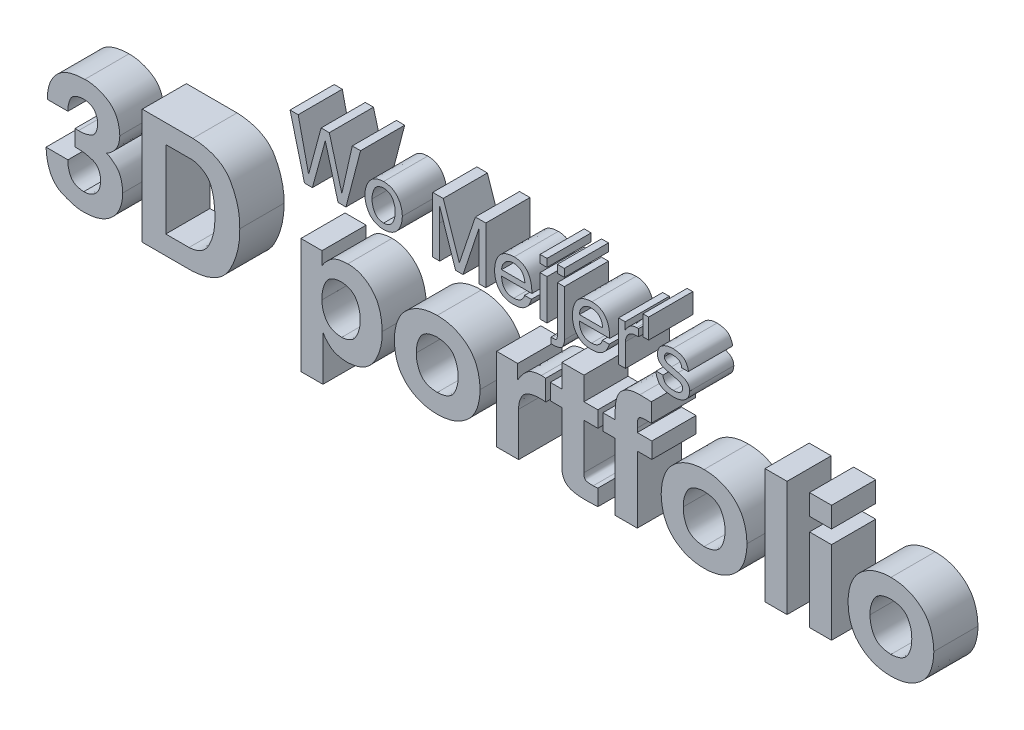
from build123d import *

# Parameters (mm, degrees)
BOSS_EXTRUDE1_DEPTH    = 5
BOSS_EXTRUDE1_2_DEPTH  = 5
BOSS_EXTRUDE1_3_DEPTH  = 5
BOSS_EXTRUDE1_4_DEPTH  = 5
SKETCH1_W              = 0.789929013
SKETCH1_H              = 4.556100763
BOSS_EXTRUDE1_5_DEPTH  = 5
SKETCH1_H_2            = 0.880655989
BOSS_EXTRUDE1_6_DEPTH  = 5
BOSS_EXTRUDE1_7_DEPTH  = 5
BOSS_EXTRUDE1_8_DEPTH  = 5
BOSS_EXTRUDE1_9_DEPTH  = 5
BOSS_EXTRUDE1_10_DEPTH = 5
SKETCH1_W_2            = 0.642136076
SKETCH1_H_3            = 2.257665771
BOSS_EXTRUDE1_11_DEPTH = 5
BOSS_EXTRUDE1_12_DEPTH = 5
BOSS_EXTRUDE1_13_DEPTH = 5
BOSS_EXTRUDE1_14_DEPTH = 5
BOSS_EXTRUDE1_15_DEPTH = 5
BOSS_EXTRUDE1_16_DEPTH = 5
BOSS_EXTRUDE1_17_DEPTH = 5
BOSS_EXTRUDE1_18_DEPTH = 5
BOSS_EXTRUDE1_19_DEPTH = 5
BOSS_EXTRUDE1_20_DEPTH = 5
SKETCH1_W_3            = 2.49700331
SKETCH1_H_4            = 13.072533334
BOSS_EXTRUDE1_21_DEPTH = 5
SKETCH1_W_4            = 2.497003311
SKETCH1_H_5            = 9.37949277
BOSS_EXTRUDE1_22_DEPTH = 5
SKETCH1_H_6            = 2.329137714
BOSS_EXTRUDE1_23_DEPTH = 5
BOSS_EXTRUDE1_24_DEPTH = 5


with BuildPart() as part:
    # Sketch1 → Boss-Extrude1 (new body)
    with BuildSketch(Plane.XY):
        Polygon((-18.72254478, 5.305254333), (-18.70504364, 5.305254333), (-17.269950129, 0.005095064), (-16.377391971, 0.005095064), (-14.723236838, 6.355095064), (-15.659845216, 6.355095064), (-16.83242162, 1.136476726), (-16.849922761, 1.136476726), (-18.25876456, 6.355095064), (-19.186325, 6.355095064), (-20.595166799, 1.136476726), (-20.61266794, 1.136476726), (-21.785244344, 6.355095064), (-22.704054214, 6.355095064), (-21.067697589, 0.005096308), (-20.175139431, 0.005096308), align=None)
    extrude(amount=BOSS_EXTRUDE1_DEPTH)


with BuildPart() as body_2:
    # Sketch1 → Boss-Extrude1 2 (new body)
    with BuildSketch(Plane.XY):
        with BuildLine():
            add(Edge.make_bspline(
                [(-14.221886276, 2.28320579), (-14.220717581, 2.208376834), (-14.21840798, 2.060498186), (-14.194662247, 1.841975864), (-14.156311752, 1.629784239), (-14.096765118, 1.424947712), (-14.027231137, 1.224403866), (-13.936849938, 1.031330235), (-13.830396134, 0.845287487), (-13.711089482, 0.665411194), (-13.572912123, 0.499783454), (-13.4161498, 0.353088862), (-13.241728049, 0.227136996), (-13.048564234, 0.123818633), (-12.838361703, 0.040417222), (-12.610257622, -0.019617812), (-12.365444501, -0.061255092), (-12.196058429, -0.071281328), (-12.10882825, -0.076444623)],
                knots=[0, 0, 0, 0, 1.010434745, 1.996843632, 2.965612006, 3.91910867, 4.875362605, 5.830169965, 6.793624193, 7.768977663, 8.742219959, 9.700107268, 10.661766476, 11.639731475, 12.651764784, 13.709387668, 14.820383986, 16, 16, 16, 16], degree=3))
            add(Edge.make_bspline(
                [(-12.10882825, -0.076444623), (-12.021601483, -0.071268609), (-11.852222035, -0.061217677), (-11.607767182, -0.019823174), (-11.380212866, 0.040666478), (-11.170359704, 0.123793816), (-10.977204438, 0.227143492), (-10.802779584, 0.353086907), (-10.646021355, 0.499784866), (-10.507830499, 0.665407459), (-10.388573748, 0.845300947), (-10.28193654, 1.031280989), (-10.192171783, 1.224716608), (-10.120121643, 1.424433585), (-10.063157383, 1.630058215), (-10.024075183, 1.841930232), (-10.000728839, 2.060502139), (-9.997860041, 2.208342764), (-9.996408507, 2.283146067)],
                knots=[0, 0, 0, 0, 1.180007467, 2.291372466, 3.343806621, 4.356175771, 5.334465305, 6.296443638, 7.25464882, 8.228214083, 9.203891223, 10.16766517, 11.122789381, 12.081303833, 13.033579214, 14.002669072, 14.989405296, 16, 16, 16, 16], degree=3))
            add(Edge.make_bspline(
                [(-9.996408507, 2.283146067), (-9.997844888, 2.35795006), (-10.000675627, 2.505369618), (-10.024140698, 2.723513961), (-10.063397194, 2.935312503), (-10.119610174, 3.141175053), (-10.192508045, 3.340605498), (-10.281891036, 3.533752894), (-10.388586157, 3.719712796), (-10.507827163, 3.899611759), (-10.646022233, 4.065232886), (-10.80277935, 4.211931233), (-10.977204502, 4.337874543), (-11.170359686, 4.441224248), (-11.380212871, 4.524351578), (-11.607767181, 4.584841232), (-11.852222035, 4.626235735), (-12.021601483, 4.636286667), (-12.10882825, 4.641462681)],
                knots=[0, 0, 0, 0, 1.010946302, 1.992316872, 2.961743887, 3.919886978, 4.873340867, 5.828797377, 6.792906633, 7.768923223, 8.742827201, 9.701365754, 10.663678771, 11.642308664, 12.655030028, 13.707830338, 14.819581994, 16, 16, 16, 16], degree=3))
            add(Edge.make_bspline(
                [(-12.10882825, 4.641462681), (-12.196058429, 4.636299385), (-12.365444501, 4.62627315), (-12.610257623, 4.584635871), (-12.838361698, 4.524600834), (-13.048564252, 4.441199431), (-13.241727985, 4.33788104), (-13.416150034, 4.211929276), (-13.572911249, 4.065234306), (-13.711092805, 3.899607998), (-13.830383773, 3.719726353), (-13.936895266, 3.533703292), (-14.026894053, 3.340919912), (-14.097280072, 3.140660449), (-14.156060093, 2.935584847), (-14.194641427, 2.723470296), (-14.218293568, 2.505380977), (-14.221098689, 2.357953884), (-14.221886276, 2.28320579)],
                knots=[0, 0, 0, 0, 1.18004068, 2.29143696, 3.349440593, 4.361838237, 5.340155307, 6.302160716, 7.260392868, 8.233985534, 9.209690135, 10.17349121, 11.128642304, 12.07983716, 13.039202847, 14.008319981, 14.989376851, 16, 16, 16, 16], degree=3))
        make_face()
        with BuildLine():
            add(Edge.make_bspline(
                [(-13.420489326, 2.28320579), (-13.421223717, 2.32523356), (-13.42271641, 2.410657512), (-13.415174304, 2.540170794), (-13.396702914, 2.671998649), (-13.369935511, 2.80602422), (-13.333748407, 2.94286092), (-13.289568945, 3.08251007), (-13.235233458, 3.22425677), (-13.174703677, 3.366925519), (-13.102356992, 3.504434617), (-13.008537357, 3.625819079), (-12.899440759, 3.73141907), (-12.77327395, 3.820421437), (-12.629814015, 3.88976271), (-12.471582379, 3.945624669), (-12.295759684, 3.981679785), (-12.172678957, 3.993299749), (-12.10882825, 3.999327849)],
                knots=[0, 0, 0, 0, 0.831267249, 1.689600308, 2.562808851, 3.462330373, 4.39145095, 5.361154977, 6.358129398, 7.392791116, 8.426599927, 9.42127125, 10.413420772, 11.420256006, 12.460902409, 13.555485803, 14.731857012, 16, 16, 16, 16], degree=3))
            add(Edge.make_bspline(
                [(-12.10882825, 3.999327849), (-12.04496538, 3.993352464), (-11.922275015, 3.981872833), (-11.746620134, 3.94518453), (-11.588208809, 3.890006238), (-11.44453567, 3.820781887), (-11.319379283, 3.730983796), (-11.210355946, 3.625870806), (-11.11658403, 3.504420132), (-11.044224029, 3.366929472), (-10.98369794, 3.224255752), (-10.929361138, 3.08251033), (-10.885183311, 2.942860857), (-10.848991214, 2.806024227), (-10.822241341, 2.671998679), (-10.803707198, 2.540170672), (-10.796390556, 2.410638596), (-10.797337147, 2.325193889), (-10.79780297, 2.283146067)],
                knots=[0, 0, 0, 0, 1.26867882, 2.437326508, 3.540309132, 4.581395242, 5.581795928, 6.574364666, 7.569456271, 8.6037019, 9.638800798, 10.636196474, 11.606310233, 12.535823394, 13.435724995, 14.309302497, 15.16799823, 16, 16, 16, 16], degree=3))
            add(Edge.make_bspline(
                [(-10.79780297, 2.283146067), (-10.797338809, 2.241098544), (-10.796395594, 2.155654443), (-10.803686138, 2.026117682), (-10.822381144, 1.893895331), (-10.848845091, 1.759394946), (-10.884929585, 1.622495452), (-10.929907115, 1.483123996), (-10.983351107, 1.341057966), (-11.044276025, 1.198107641), (-11.116570687, 1.060593036), (-11.210359452, 0.939148536), (-11.319378337, 0.834033916), (-11.444535935, 0.744236268), (-11.588208732, 0.675011791), (-11.746620156, 0.619833536), (-11.922275009, 0.583145222), (-12.044965378, 0.571665593), (-12.10882825, 0.565690209)],
                knots=[0, 0, 0, 0, 0.831580684, 1.689841821, 2.562977197, 3.470661528, 4.399704252, 5.361326007, 6.36607751, 7.400652531, 8.434374717, 9.428962695, 10.421029083, 11.420923454, 12.461482659, 13.563907051, 14.731963273, 16, 16, 16, 16], degree=3))
            add(Edge.make_bspline(
                [(-12.10882825, 0.565690209), (-12.17267896, 0.571718308), (-12.29575969, 0.58333827), (-12.471582357, 0.619393397), (-12.629814091, 0.67525532), (-12.773273684, 0.744596719), (-12.89944171, 0.833598639), (-13.008533854, 0.939200263), (-13.102370328, 1.060578551), (-13.174651705, 1.198111594), (-13.235580211, 1.341056939), (-13.289023276, 1.483124255), (-13.33400104, 1.622495386), (-13.370085474, 1.759394963), (-13.396549437, 1.893895327), (-13.415244439, 2.026117683), (-13.422534984, 2.155654443), (-13.421591769, 2.241098544), (-13.420489326, 2.28320579)],
                knots=[0, 0, 0, 0, 1.267471103, 2.44321905, 3.537222513, 4.577317563, 5.583619358, 6.575243221, 7.569387549, 8.60264863, 9.636762165, 10.641065484, 11.602258296, 12.530886608, 13.438166054, 14.310911955, 15.168790254, 16, 16, 16, 16], degree=3))
        make_face(mode=Mode.SUBTRACT)
    extrude(amount=BOSS_EXTRUDE1_2_DEPTH)


with BuildPart() as body_3:
    # Sketch1 → Boss-Extrude1 3 (new body)
    with BuildSketch(Plane.XY):
        with BuildLine():
            Line((-0.542758066, 0.005095064), (-0.542758066, 6.355095064))
            Line((-0.542758066, 6.355095064), (-1.722323231, 6.355095064))
            Line((-1.722323231, 6.355095064), (-3.529268072, 0.973394864))
            Line((-3.529268072, 0.973394864), (-3.546983217, 0.973394864))
            Line((-3.546983217, 0.973394864), (-5.362785631, 6.355095064))
            Line((-5.362785631, 6.355095064), (-6.551305418, 6.355095064))
            Line((-6.551305418, 6.355095064), (-6.551305418, 0.005096308))
            Line((-6.551305418, 0.005096308), (-5.761376404, 0.005096308))
            Line((-5.761376404, 0.005096308), (-5.761376404, 3.748541211))
            add(Edge.make_bspline(
                [(-5.761376404, 3.748541211), (-5.761833324, 3.787119054), (-5.762888806, 3.876233597), (-5.76380897, 4.0282126), (-5.76653065, 4.215927176), (-5.771952027, 4.512767553), (-5.777461127, 4.903479783), (-5.778633049, 5.219891571), (-5.779213483, 5.376605136)],
                knots=[0, 0, 0, 0, 0.42651968, 0.985257429, 1.68019707, 2.501961944, 4.267479171, 6, 6, 6, 6], degree=3))
            Line((-5.779213483, 5.376605136), (-5.761376404, 5.377800828))
            Line((-5.761376404, 5.377800828), (-3.972146709, 0.005095064))
            Line((-3.972146709, 0.005095064), (-3.121819725, 0.005095064))
            Line((-3.121819725, 0.005095064), (-1.332687079, 5.386795264))
            Line((-1.332687079, 5.386795264), (-1.315880211, 5.386795264))
            add(Edge.make_bspline(
                [(-1.315880211, 5.386795264), (-1.316550338, 5.22795909), (-1.317890643, 4.910274439), (-1.323378766, 4.519137792), (-1.328726168, 4.2269681), (-1.331534025, 4.046050139), (-1.33239531, 3.904618357), (-1.333498849, 3.823080148), (-1.333958668, 3.789105136)],
                knots=[0, 0, 0, 0, 1.789368315, 3.57887521, 4.406692244, 5.081353491, 5.617222078, 6, 6, 6, 6], degree=3))
            Line((-1.333958668, 3.789105136), (-1.332687079, 0.005095064))
            Line((-1.332687079, 0.005095064), (-0.542758066, 0.005095064))
        make_face()
    extrude(amount=BOSS_EXTRUDE1_3_DEPTH)


with BuildPart() as body_4:
    # Sketch1 → Boss-Extrude1 4 (new body)
    with BuildSketch(Plane.XY):
        with BuildLine():
            add(Edge.make_bspline(
                [(3.843973812, 1.455336902), (3.835816427, 1.408328759), (3.818656185, 1.309440306), (3.747792408, 1.164873539), (3.641481825, 1.020789204), (3.530172, 0.90191714), (3.4228292, 0.812456059), (3.331993456, 0.75046921), (3.232130709, 0.69920174), (3.125665711, 0.653526701), (3.011054304, 0.618614924), (2.888835336, 0.591529441), (2.758801071, 0.574050672), (2.669238045, 0.568523597), (2.623324639, 0.565690209)],
                knots=[0, 0, 0, 0, 1.045621633, 2.199616861, 3.498929007, 4.979694664, 5.769421848, 6.570349839, 7.393858746, 8.23567067, 9.116520442, 10.025765232, 10.987932334, 12, 12, 12, 12], degree=3))
            add(Edge.make_bspline(
                [(2.623324639, 0.565690209), (2.568049762, 0.566809131), (2.460549543, 0.568985245), (2.305039453, 0.588757844), (2.159723192, 0.618574687), (2.025402712, 0.662320391), (1.901170665, 0.716693178), (1.787993505, 0.783673444), (1.684910709, 0.86185994), (1.592803632, 0.952633367), (1.512895544, 1.055409182), (1.441911258, 1.167323093), (1.381597488, 1.289626856), (1.335854554, 1.423328929), (1.296473402, 1.565147914), (1.270740394, 1.717985517), (1.253514932, 1.880564167), (1.251946771, 1.992608214), (1.25114366, 2.049989968)],
                knots=[0, 0, 0, 0, 1.149695717, 2.235962341, 3.256849789, 4.232198796, 5.169867017, 6.073173562, 6.962231957, 7.855846511, 8.75573151, 9.665327547, 10.609924802, 11.585433939, 12.601567341, 13.669452983, 14.806443735, 16, 16, 16, 16], degree=3))
            Line((1.25114366, 2.049989968), (4.681596108, 2.051262801))
            add(Edge.make_bspline(
                [(4.681596108, 2.051262801), (4.679959272, 2.149415928), (4.676773081, 2.340476467), (4.653428388, 2.619144346), (4.616374239, 2.882036343), (4.561236015, 3.127968343), (4.492826947, 3.358009909), (4.408190736, 3.571420484), (4.304810758, 3.767109927), (4.189956036, 3.948036458), (4.057208746, 4.109718481), (3.906537878, 4.249835711), (3.740083991, 4.369103442), (3.556986711, 4.466604383), (3.357955401, 4.54313522), (3.142629162, 4.59900231), (2.911104893, 4.633808176), (2.751281399, 4.638865231), (2.669191413, 4.641462681)],
                knots=[0, 0, 0, 0, 1.264772922, 2.461951054, 3.601285669, 4.683477252, 5.706756008, 6.691564738, 7.636496798, 8.554953373, 9.449117905, 10.324287547, 11.199097738, 12.080576528, 12.990234278, 13.940713329, 14.942290586, 16, 16, 16, 16], degree=3))
            add(Edge.make_bspline(
                [(2.669191413, 4.641462681), (2.576048413, 4.638086303), (2.395401041, 4.631537945), (2.134472071, 4.593725624), (1.892728197, 4.537285102), (1.670098769, 4.45964737), (1.467588887, 4.360111303), (1.284791609, 4.239322603), (1.12147179, 4.098116017), (0.978656551, 3.936670697), (0.855566484, 3.758430747), (0.748329537, 3.568097103), (0.657324955, 3.365584848), (0.583864053, 3.150944451), (0.525787888, 2.924406633), (0.487893717, 2.685500266), (0.462049386, 2.434908638), (0.460654883, 2.263680094), (0.459941814, 2.176123596)],
                knots=[0, 0, 0, 0, 1.188428002, 2.304911783, 3.357632658, 4.351595847, 5.306356651, 6.229091166, 7.139477047, 8.052937613, 8.971366595, 9.898180759, 10.836767862, 11.799795678, 12.789377546, 13.816462519, 14.883463626, 16, 16, 16, 16], degree=3))
            add(Edge.make_bspline(
                [(0.459941814, 2.176123596), (0.461524242, 2.094500356), (0.464615629, 1.93504345), (0.492497093, 1.70256363), (0.534549571, 1.482017719), (0.59068707, 1.272425779), (0.66668812, 1.075815438), (0.757267967, 0.890763836), (0.864932742, 0.717951384), (0.988218175, 0.557515975), (1.126695714, 0.411241878), (1.282456089, 0.284985818), (1.451184371, 0.175055071), (1.636527135, 0.087759988), (1.835411205, 0.017329911), (2.048686927, -0.034982148), (2.277146886, -0.066608253), (2.434238553, -0.073103982), (2.51502809, -0.076444623)],
                knots=[0, 0, 0, 0, 1.138007361, 2.223179726, 3.260549351, 4.267856816, 5.244679869, 6.195660312, 7.13744695, 8.07930809, 9.013539367, 9.939566623, 10.869506888, 11.815308265, 12.789487873, 13.808034845, 14.872710095, 16, 16, 16, 16], degree=3))
            add(Edge.make_bspline(
                [(2.51502809, -0.076444623), (2.602572987, -0.075073183), (2.766459363, -0.072505812), (2.994857495, -0.051608563), (3.190003904, -0.023138874), (3.353397696, 0.019545374), (3.490406568, 0.070121646), (3.60944327, 0.118551142), (3.710641644, 0.170702708), (3.770243936, 0.20895629), (3.798023676, 0.226785714)],
                knots=[0, 0, 0, 0, 1.570055538, 2.939185739, 4.111528235, 5.103822751, 5.961696316, 6.729984467, 7.40806469, 8, 8, 8, 8], degree=3))
            add(Edge.make_bspline(
                [(3.798023676, 0.226785714), (3.86637224, 0.277080462), (3.997922875, 0.373882876), (4.169193546, 0.539302254), (4.311310567, 0.712026985), (4.417505931, 0.892814734), (4.496671272, 1.06447982), (4.560918633, 1.214353605), (4.603208514, 1.341752971), (4.61473414, 1.420403647), (4.619803371, 1.454995987)],
                knots=[0, 0, 0, 0, 1.34093896, 2.580908256, 3.755908808, 4.867624748, 5.886246646, 6.744533261, 7.447817417, 8, 8, 8, 8], degree=3))
            Line((4.619803371, 1.454995987), (3.843973812, 1.455336902))
        make_face()
        with BuildLine():
            add(Edge.make_bspline(
                [(1.25114366, 2.678109952), (1.253418331, 2.721907673), (1.257899201, 2.808184709), (1.276598351, 2.935197548), (1.309353567, 3.056835234), (1.351525076, 3.174443309), (1.403132498, 3.288148025), (1.468044249, 3.396050801), (1.543558703, 3.499619853), (1.629230845, 3.597662884), (1.723036795, 3.688695487), (1.825289152, 3.767260055), (1.932892821, 3.8357142), (2.046683252, 3.891596054), (2.166432403, 3.936989499), (2.292516169, 3.969465047), (2.424683973, 3.991864272), (2.514939235, 3.996809744), (2.560894864, 3.999327849)],
                knots=[0, 0, 0, 0, 1.022432737, 2.01408804, 2.986970884, 3.95495176, 4.925411983, 5.893544839, 6.885991093, 7.910819299, 8.926466382, 9.928844721, 10.912505677, 11.895767703, 12.879877261, 13.893591065, 14.927471436, 16, 16, 16, 16], degree=3))
            add(Edge.make_bspline(
                [(2.560894864, 3.999327849), (2.618301239, 3.996861836), (2.728836455, 3.992113561), (2.887830836, 3.970219839), (3.033799806, 3.937484493), (3.166921953, 3.893354796), (3.286775938, 3.836971036), (3.39359823, 3.769127618), (3.487695678, 3.689555273), (3.568157396, 3.598265505), (3.635896204, 3.498526145), (3.695929224, 3.394835291), (3.749159571, 3.287204495), (3.791992347, 3.173974465), (3.826156074, 3.056247973), (3.853427769, 2.934664547), (3.871101478, 2.808074228), (3.876712969, 2.721901209), (3.879564607, 2.678109952)],
                knots=[0, 0, 0, 0, 1.309130389, 2.520713257, 3.652602543, 4.714834108, 5.710774521, 6.66407325, 7.591209626, 8.510071686, 9.428423692, 10.334965256, 11.239799633, 12.162071778, 13.090218327, 14.032045409, 14.999928205, 16, 16, 16, 16], degree=3))
            Line((3.879564607, 2.678109952), (1.25114366, 2.678109952))
        make_face(mode=Mode.SUBTRACT)
    extrude(amount=BOSS_EXTRUDE1_4_DEPTH)


with BuildPart() as body_5:
    # Sketch1 → Boss-Extrude1 5 (new body)
    with BuildSketch(Plane.XY):
        with Locations((5.993257805, 2.283145446)):
            Rectangle(SKETCH1_W, SKETCH1_H)
    extrude(amount=BOSS_EXTRUDE1_5_DEPTH)


with BuildPart() as body_6:
    # Sketch1 → Boss-Extrude1 6 (new body)
    with BuildSketch(Plane.XY):
        with Locations((5.993257805, 5.911715007)):
            Rectangle(SKETCH1_W, SKETCH1_H_2)
    extrude(amount=BOSS_EXTRUDE1_6_DEPTH)


with BuildPart() as body_7:
    # Sketch1 → Boss-Extrude1 7 (new body)
    with BuildSketch(Plane.XY):
        with BuildLine():
            Line((8.345204655, 4.561195827), (7.555275642, 4.561195827))
            Line((7.555275642, 4.561195827), (7.555275642, -0.588064943))
            add(Edge.make_bspline(
                [(7.555275642, -0.588064943), (7.55498018, -0.617975608), (7.554420184, -0.67466592), (7.55163402, -0.755801729), (7.542074999, -0.827534719), (7.531624802, -0.891421164), (7.514652774, -0.946320556), (7.495325598, -0.99363561), (7.470375725, -1.031803288), (7.431352083, -1.073393607), (7.361023313, -1.109069496), (7.258209902, -1.137322051), (7.12828318, -1.149815889), (7.033751365, -1.147783315), (6.981942215, -1.146669342)],
                knots=[0, 0, 0, 0, 1.104926701, 2.094190752, 2.994942604, 3.776355774, 4.480952173, 5.113227916, 5.657018987, 6.156230463, 7.202891809, 8.508506773, 10.086450642, 12, 12, 12, 12], degree=3))
            Line((6.981942215, -1.146669342), (6.82433117, -1.146668098))
            Line((6.82433117, -1.146668098), (6.82433117, -1.788805418))
            add(Edge.make_bspline(
                [(6.82433117, -1.788805418), (6.879841185, -1.787511438), (6.988438464, -1.784979955), (7.097033982, -1.787548535), (7.150120385, -1.788804173)],
                knots=[0, 0, 0, 0, 1.022309494, 2, 2, 2, 2], degree=3))
            add(Edge.make_bspline(
                [(7.150120385, -1.788804173), (7.216450832, -1.785538268), (7.342731254, -1.779320611), (7.522146566, -1.755168213), (7.681691669, -1.720077933), (7.82165048, -1.674774629), (7.942316951, -1.618956345), (8.042880037, -1.551357619), (8.124830273, -1.472554504), (8.201520295, -1.353520751), (8.267259715, -1.200335147), (8.324110621, -1.020270845), (8.353816463, -0.845608582), (8.348020419, -0.731816165), (8.345204655, -0.676534912)],
                knots=[0, 0, 0, 0, 1.264660654, 2.407670828, 3.444005448, 4.372687862, 5.205034789, 5.967961982, 6.671622875, 7.35374668, 8.649996774, 9.83484432, 10.948150292, 12, 12, 12, 12], degree=3))
            Line((8.345204655, -0.676534912), (8.345204655, 4.561195827))
        make_face()
    extrude(amount=BOSS_EXTRUDE1_7_DEPTH)


with BuildPart() as body_8:
    # Sketch1 → Boss-Extrude1 8 (new body)
    with BuildSketch(Plane.XY):
        with Locations((7.950240149, 5.911715007)):
            Rectangle(SKETCH1_W, SKETCH1_H_2)
    extrude(amount=BOSS_EXTRUDE1_8_DEPTH)


with BuildPart() as body_9:
    # Sketch1 → Boss-Extrude1 9 (new body)
    with BuildSketch(Plane.XY):
        with BuildLine():
            add(Edge.make_bspline(
                [(12.650394358, 1.455336902), (12.642236973, 1.408328759), (12.62507673, 1.309440306), (12.554212953, 1.164873539), (12.44790237, 1.020789204), (12.336592545, 0.90191714), (12.229249746, 0.812456059), (12.138414002, 0.75046921), (12.038551255, 0.69920174), (11.932086257, 0.653526701), (11.81747485, 0.618614924), (11.695255882, 0.591529441), (11.565221617, 0.574050672), (11.475658591, 0.568523597), (11.429745185, 0.565690209)],
                knots=[0, 0, 0, 0, 1.045621633, 2.199616861, 3.498929007, 4.979694664, 5.769421848, 6.570349839, 7.393858746, 8.23567067, 9.116520442, 10.025765232, 10.987932334, 12, 12, 12, 12], degree=3))
            add(Edge.make_bspline(
                [(11.429745185, 0.565690209), (11.374470308, 0.566809131), (11.266970088, 0.568985245), (11.111459999, 0.588757844), (10.966143738, 0.618574687), (10.831823258, 0.662320391), (10.70759121, 0.716693178), (10.594414051, 0.783673444), (10.491331255, 0.86185994), (10.399224177, 0.952633367), (10.31931609, 1.055409182), (10.248331803, 1.167323093), (10.188018034, 1.289626856), (10.1422751, 1.423328929), (10.102893947, 1.565147914), (10.07716094, 1.717985517), (10.059935478, 1.880564167), (10.058367317, 1.992608214), (10.057564205, 2.049989968)],
                knots=[0, 0, 0, 0, 1.149695717, 2.235962341, 3.256849789, 4.232198796, 5.169867017, 6.073173562, 6.962231957, 7.855846511, 8.75573151, 9.665327547, 10.609924802, 11.585433939, 12.601567341, 13.669452983, 14.806443735, 16, 16, 16, 16], degree=3))
            Line((10.057564205, 2.049989968), (13.488016653, 2.051262801))
            add(Edge.make_bspline(
                [(13.488016653, 2.051262801), (13.486379818, 2.149415928), (13.483193627, 2.340476467), (13.459848934, 2.619144346), (13.422794785, 2.882036343), (13.367656561, 3.127968343), (13.299247492, 3.358009909), (13.214611282, 3.571420484), (13.111231303, 3.767109927), (12.996376581, 3.948036458), (12.863629292, 4.109718481), (12.712958424, 4.249835711), (12.546504537, 4.369103442), (12.363407256, 4.466604383), (12.164375947, 4.54313522), (11.949049708, 4.59900231), (11.717525439, 4.633808176), (11.557701945, 4.638865231), (11.475611958, 4.641462681)],
                knots=[0, 0, 0, 0, 1.264772922, 2.461951054, 3.601285669, 4.683477252, 5.706756008, 6.691564738, 7.636496798, 8.554953373, 9.449117905, 10.324287547, 11.199097738, 12.080576528, 12.990234278, 13.940713329, 14.942290586, 16, 16, 16, 16], degree=3))
            add(Edge.make_bspline(
                [(11.475611958, 4.641462681), (11.382468959, 4.638086303), (11.201821587, 4.631537945), (10.940892617, 4.593725624), (10.699148743, 4.537285102), (10.476519314, 4.45964737), (10.274009433, 4.360111303), (10.091212155, 4.239322603), (9.927892336, 4.098116017), (9.785077097, 3.936670697), (9.66198703, 3.758430747), (9.554750083, 3.568097103), (9.463745501, 3.365584848), (9.390284599, 3.150944451), (9.332208434, 2.924406633), (9.294314263, 2.685500266), (9.268469932, 2.434908638), (9.267075429, 2.263680094), (9.26636236, 2.176123596)],
                knots=[0, 0, 0, 0, 1.188428002, 2.304911783, 3.357632658, 4.351595847, 5.306356651, 6.229091166, 7.139477047, 8.052937613, 8.971366595, 9.898180759, 10.836767862, 11.799795678, 12.789377546, 13.816462519, 14.883463626, 16, 16, 16, 16], degree=3))
            add(Edge.make_bspline(
                [(9.26636236, 2.176123596), (9.267944787, 2.094500356), (9.271036175, 1.93504345), (9.298917639, 1.70256363), (9.340970116, 1.482017719), (9.397107616, 1.272425779), (9.473108665, 1.075815438), (9.563688513, 0.890763836), (9.671353288, 0.717951384), (9.794638721, 0.557515975), (9.93311626, 0.411241878), (10.088876635, 0.284985818), (10.257604917, 0.175055071), (10.442947681, 0.087759988), (10.64183175, 0.017329911), (10.855107473, -0.034982148), (11.083567431, -0.066608253), (11.240659098, -0.073103982), (11.321448636, -0.076444623)],
                knots=[0, 0, 0, 0, 1.138007361, 2.223179726, 3.260549351, 4.267856816, 5.244679869, 6.195660312, 7.13744695, 8.07930809, 9.013539367, 9.939566623, 10.869506888, 11.815308265, 12.789487873, 13.808034845, 14.872710095, 16, 16, 16, 16], degree=3))
            add(Edge.make_bspline(
                [(11.321448636, -0.076444623), (11.408993533, -0.075073183), (11.572879909, -0.072505812), (11.801278041, -0.051608563), (11.99642445, -0.023138874), (12.159818242, 0.019545374), (12.296827114, 0.070121646), (12.415863816, 0.118551142), (12.51706219, 0.170702708), (12.576664482, 0.20895629), (12.604444222, 0.226785714)],
                knots=[0, 0, 0, 0, 1.570055538, 2.939185739, 4.111528235, 5.103822751, 5.961696316, 6.729984467, 7.40806469, 8, 8, 8, 8], degree=3))
            add(Edge.make_bspline(
                [(12.604444222, 0.226785714), (12.672792785, 0.277080462), (12.804343421, 0.373882876), (12.975614092, 0.539302254), (13.117731113, 0.712026985), (13.223926477, 0.892814734), (13.303091818, 1.06447982), (13.367339179, 1.214353605), (13.409629059, 1.341752971), (13.421154686, 1.420403647), (13.426223917, 1.454995987)],
                knots=[0, 0, 0, 0, 1.34093896, 2.580908256, 3.755908808, 4.867624748, 5.886246646, 6.744533261, 7.447817417, 8, 8, 8, 8], degree=3))
            Line((13.426223917, 1.454995987), (12.650394358, 1.455336902))
        make_face()
        with BuildLine():
            add(Edge.make_bspline(
                [(10.057564205, 2.678109952), (10.059838877, 2.721907673), (10.064319747, 2.808184709), (10.083018897, 2.935197548), (10.115774113, 3.056835234), (10.157945622, 3.174443309), (10.209553044, 3.288148025), (10.274464795, 3.396050801), (10.349979248, 3.499619853), (10.435651391, 3.597662884), (10.52945734, 3.688695487), (10.631709698, 3.767260055), (10.739313367, 3.8357142), (10.853103797, 3.891596054), (10.972852949, 3.936989499), (11.098936714, 3.969465047), (11.231104519, 3.991864272), (11.321359781, 3.996809744), (11.367315409, 3.999327849)],
                knots=[0, 0, 0, 0, 1.022432737, 2.01408804, 2.986970884, 3.95495176, 4.925411983, 5.893544839, 6.885991093, 7.910819299, 8.926466382, 9.928844721, 10.912505677, 11.895767703, 12.879877261, 13.893591065, 14.927471436, 16, 16, 16, 16], degree=3))
            add(Edge.make_bspline(
                [(11.367315409, 3.999327849), (11.424721785, 3.996861836), (11.535257001, 3.992113561), (11.694251382, 3.970219839), (11.840220352, 3.937484493), (11.973342498, 3.893354796), (12.093196484, 3.836971036), (12.200018776, 3.769127618), (12.294116224, 3.689555273), (12.374577942, 3.598265505), (12.44231675, 3.498526145), (12.50234977, 3.394835291), (12.555580117, 3.287204495), (12.598412893, 3.173974465), (12.63257662, 3.056247973), (12.659848314, 2.934664547), (12.677522024, 2.808074228), (12.683133515, 2.721901209), (12.685985152, 2.678109952)],
                knots=[0, 0, 0, 0, 1.309130389, 2.520713257, 3.652602543, 4.714834108, 5.710774521, 6.66407325, 7.591209626, 8.510071686, 9.428423692, 10.334965256, 11.239799633, 12.162071778, 13.090218327, 14.032045409, 14.999928205, 16, 16, 16, 16], degree=3))
            Line((12.685985152, 2.678109952), (10.057564205, 2.678109952))
        make_face(mode=Mode.SUBTRACT)
    extrude(amount=BOSS_EXTRUDE1_9_DEPTH)


with BuildPart() as body_10:
    # Sketch1 → Boss-Extrude1 10 (new body)
    with BuildSketch(Plane.XY):
        with BuildLine():
            add(Edge.make_bspline(
                [(15.276183788, 2.628957204), (15.277691483, 2.670015389), (15.280676541, 2.75130575), (15.295774866, 2.870598549), (15.321207983, 2.984997169), (15.357594917, 3.093834836), (15.401580682, 3.198219655), (15.456029318, 3.297477319), (15.51928777, 3.391913661), (15.593434011, 3.479208839), (15.674937267, 3.560360101), (15.764922248, 3.630954554), (15.861966203, 3.692292262), (15.966654796, 3.741359559), (16.078746069, 3.78158151), (16.198011719, 3.809996923), (16.324554806, 3.829934318), (16.411309066, 3.834100702), (16.455979133, 3.836245987)],
                knots=[0, 0, 0, 0, 1.044404791, 2.067798245, 3.052925257, 4.019406908, 4.98226152, 5.929484733, 6.8939732, 7.867428808, 8.837283457, 9.813849155, 10.769713473, 11.750331327, 12.747753416, 13.792854642, 14.863533271, 16, 16, 16, 16], degree=3))
            Line((16.455979133, 3.836245987), (16.746879291, 3.837517576))
            Line((16.746879291, 3.837517576), (16.746879291, 4.642736758))
            add(Edge.make_bspline(
                [(16.746879291, 4.642736758), (16.717443069, 4.641042908), (16.649816577, 4.637151473), (16.582120191, 4.639906725), (16.543890449, 4.641462681)],
                knots=[0, 0, 0, 0, 0.870552966, 2, 2, 2, 2], degree=3))
            add(Edge.make_bspline(
                [(16.543890449, 4.641462681), (16.473970791, 4.638177928), (16.337249403, 4.631754899), (16.139754577, 4.584348489), (15.956724135, 4.509007312), (15.789717233, 4.403477005), (15.6366698, 4.274672249), (15.494361152, 4.125313915), (15.362747006, 3.955831661), (15.286875006, 3.831101347), (15.248154093, 3.767445827)],
                knots=[0, 0, 0, 0, 1.021085699, 1.996638112, 2.951032412, 3.901706021, 4.871217803, 5.867711059, 6.911796522, 8, 8, 8, 8], degree=3))
            Line((15.248154093, 3.767445827), (15.231347225, 3.768265765))
            Line((15.231347225, 3.768265765), (15.231347225, 4.561195827))
            Line((15.231347225, 4.561195827), (14.486254775, 4.561195827))
            Line((14.486254775, 4.561195827), (14.486254775, 0.005095064))
            Line((14.486254775, 0.005095064), (15.276183788, 0.005095064))
            Line((15.276183788, 0.005095064), (15.276183788, 2.628957204))
        make_face()
    extrude(amount=BOSS_EXTRUDE1_10_DEPTH)


with BuildPart() as body_11:
    # Sketch1 → Boss-Extrude1 11 (new body)
    with BuildSketch(Plane.XY):
        with Locations((17.572070004, 5.218617717)):
            Rectangle(SKETCH1_W_2, SKETCH1_H_3)
    extrude(amount=BOSS_EXTRUDE1_11_DEPTH)


with BuildPart() as body_12:
    # Sketch1 → Boss-Extrude1 12 (new body)
    with BuildSketch(Plane.XY):
        with BuildLine():
            add(Edge.make_bspline(
                [(22.380765873, 3.24698162), (22.38297503, 3.267985698), (22.387726916, 3.313165355), (22.381483361, 3.386827948), (22.363919281, 3.469729882), (22.337250497, 3.562788966), (22.298119966, 3.665088163), (22.248072476, 3.777002606), (22.187452342, 3.89903749), (22.120550246, 4.030896162), (22.033726751, 4.162741095), (21.912401418, 4.276683104), (21.766455636, 4.376410785), (21.593883401, 4.462173815), (21.39344955, 4.529692625), (21.166730672, 4.582080458), (20.913825394, 4.621957659), (20.735747796, 4.634763835), (20.642596308, 4.641462681)],
                knots=[0, 0, 0, 0, 0.404983759, 0.871117898, 1.411871405, 2.031536772, 2.728533515, 3.513754739, 4.385716465, 5.345455265, 6.354642611, 7.398863895, 8.518971, 9.741133975, 11.087826682, 12.571838597, 14.206746164, 16, 16, 16, 16], degree=3))
            add(Edge.make_bspline(
                [(20.642596308, 4.641462681), (20.58607317, 4.640538591), (20.474937985, 4.638721657), (20.310700315, 4.622693755), (20.151671445, 4.598091274), (19.99758026, 4.560509575), (19.848665801, 4.512628711), (19.705447305, 4.452081976), (19.567613026, 4.381662358), (19.434829265, 4.302627911), (19.312733722, 4.210271143), (19.204400893, 4.104955294), (19.111995939, 3.987228398), (19.036741022, 3.856715863), (18.974861876, 3.715500057), (18.92898367, 3.561539745), (18.900134344, 3.395104941), (18.892245538, 3.280005598), (18.888192215, 3.220866774)],
                knots=[0, 0, 0, 0, 1.07114488, 2.106073514, 3.125132376, 4.11895066, 5.109241511, 6.087019873, 7.062675079, 8.041513291, 9.012374421, 9.957359301, 10.897807237, 11.83942587, 12.80556975, 13.814113508, 14.876876654, 16, 16, 16, 16], degree=3))
            add(Edge.make_bspline(
                [(18.888192215, 3.220866774), (18.889593556, 3.18343126), (18.892312476, 3.110797878), (18.908291335, 3.005106392), (18.931602745, 2.905225974), (18.966933955, 2.812288909), (19.008352556, 2.724242023), (19.061538492, 2.644377705), (19.121396244, 2.56895981), (19.217210755, 2.478976188), (19.353514125, 2.37610388), (19.541601576, 2.274689695), (19.753880351, 2.191054269), (19.906074768, 2.152725189), (19.985172552, 2.132804976)],
                knots=[0, 0, 0, 0, 0.798605576, 1.549475867, 2.276855671, 2.982059095, 3.666887696, 4.347929862, 5.024315378, 5.716358234, 7.146101869, 8.654496765, 10.2612904, 12, 12, 12, 12], degree=3))
            Line((19.985172552, 2.132804976), (20.856409828, 1.919185554))
            add(Edge.make_bspline(
                [(20.856409828, 1.919185554), (20.929778631, 1.900808193), (21.067260966, 1.866371726), (21.254952437, 1.805628054), (21.411023298, 1.744315165), (21.535950471, 1.678838692), (21.632420623, 1.60189986), (21.698490686, 1.507420228), (21.738843595, 1.396958436), (21.741003373, 1.317751835), (21.742124799, 1.276625201)],
                knots=[0, 0, 0, 0, 1.519896822, 2.848062863, 3.962442576, 4.886935113, 5.674966801, 6.416255513, 7.177668541, 8, 8, 8, 8], degree=3))
            add(Edge.make_bspline(
                [(21.742124799, 1.276625201), (21.740236558, 1.246825351), (21.736540396, 1.188493267), (21.72007021, 1.104533086), (21.694132791, 1.026732873), (21.659913517, 0.954903121), (21.615995302, 0.88979235), (21.564620249, 0.829808162), (21.502715976, 0.777658629), (21.408375584, 0.716753561), (21.276270706, 0.655651284), (21.104327487, 0.601334372), (20.916302541, 0.571222915), (20.7862452, 0.567575124), (20.719040931, 0.565690209)],
                knots=[0, 0, 0, 0, 0.769423926, 1.506118385, 2.198759244, 2.879611468, 3.550883741, 4.218483182, 4.909824119, 5.629720922, 7.109121375, 8.647033663, 10.267428427, 12, 12, 12, 12], degree=3))
            add(Edge.make_bspline(
                [(20.719040931, 0.565690209), (20.657828777, 0.568314538), (20.541074653, 0.5733201), (20.374674799, 0.592583074), (20.225321051, 0.619577691), (20.093006033, 0.657130661), (19.97661463, 0.699987673), (19.878012868, 0.754251579), (19.795710012, 0.816633734), (19.713371702, 0.911670852), (19.636650763, 1.035815164), (19.568748582, 1.185280666), (19.525977836, 1.333696576), (19.52205563, 1.433073951), (19.52013443, 1.481751605)],
                knots=[0, 0, 0, 0, 1.290811967, 2.462053882, 3.527575362, 4.485285444, 5.357915607, 6.135087326, 6.84942085, 7.521339673, 8.772732292, 9.910495783, 10.97650582, 12, 12, 12, 12], degree=3))
            Line((19.52013443, 1.481751605), (18.73975353, 1.482297816))
            add(Edge.make_bspline(
                [(18.73975353, 1.482297816), (18.738240193, 1.443875602), (18.735198294, 1.366644606), (18.746814584, 1.249161344), (18.76776009, 1.129522162), (18.803528993, 1.007610211), (18.848999926, 0.883098916), (18.907043052, 0.756461416), (18.97642861, 0.627561457), (19.056106604, 0.495840885), (19.157628364, 0.367601582), (19.294337757, 0.258052778), (19.458975325, 0.161914932), (19.655430881, 0.084557834), (19.880496883, 0.019353331), (20.13635401, -0.02679379), (20.421762244, -0.061980566), (20.622523582, -0.071464073), (20.72795947, -0.076444623)],
                knots=[0, 0, 0, 0, 0.640603765, 1.287652691, 1.964265768, 2.663810235, 3.403308568, 4.173578398, 4.98480318, 5.843730595, 6.739792928, 7.695671599, 8.746481378, 9.909233711, 11.207144658, 12.64910987, 14.240178695, 16, 16, 16, 16], degree=3))
            add(Edge.make_bspline(
                [(20.72795947, -0.076444623), (20.790867654, -0.074768983), (20.914419692, -0.071478018), (21.095707603, -0.051734964), (21.269366737, -0.02222314), (21.43372824, 0.022145315), (21.590783607, 0.074290677), (21.737141703, 0.143449386), (21.877417966, 0.220658312), (22.007641665, 0.311086236), (22.128109398, 0.410366845), (22.231831568, 0.522988264), (22.322293416, 0.643893142), (22.394315137, 0.776740387), (22.454158658, 0.917124317), (22.495359081, 1.068523042), (22.524599449, 1.228824226), (22.529534203, 1.339769471), (22.532052568, 1.396388443)],
                knots=[0, 0, 0, 0, 1.157500839, 2.273338373, 3.352536349, 4.395037164, 5.403323859, 6.392842414, 7.368939778, 8.346537484, 9.30607171, 10.234982663, 11.157130612, 12.077057434, 13.008790933, 13.958762997, 14.958290279, 16, 16, 16, 16], degree=3))
            add(Edge.make_bspline(
                [(22.532052568, 1.396388443), (22.531960716, 1.432951078), (22.531779599, 1.50504649), (22.518518482, 1.610402057), (22.496926294, 1.710666331), (22.466413953, 1.805694406), (22.425840145, 1.895387428), (22.373480872, 1.978591783), (22.314297444, 2.058333517), (22.242575077, 2.131060834), (22.161616171, 2.201344899), (22.066795438, 2.26522009), (21.960299959, 2.32726739), (21.84024622, 2.383334725), (21.708823734, 2.438688402), (21.564130382, 2.489532023), (21.406526322, 2.536036096), (21.296715331, 2.564214069), (21.240138443, 2.578731942)],
                knots=[0, 0, 0, 0, 0.912163654, 1.798634432, 2.645138135, 3.470047746, 4.286187303, 5.095478597, 5.920456356, 6.760359411, 7.640209892, 8.593185851, 9.609868785, 10.714943928, 11.898478822, 13.169550893, 14.541694224, 16, 16, 16, 16], degree=3))
            Line((21.240138443, 2.578731942), (20.489658538, 2.767261751))
            add(Edge.make_bspline(
                [(20.489658538, 2.767261751), (20.422341102, 2.782939766), (20.296925443, 2.812148671), (20.126006871, 2.865705236), (19.984762032, 2.920152459), (19.86917863, 2.975600664), (19.78071244, 3.047366678), (19.718499572, 3.137048759), (19.683350792, 3.246423559), (19.680764597, 3.324653936), (19.679394061, 3.366111557)],
                knots=[0, 0, 0, 0, 1.496161792, 2.787422206, 3.873427442, 4.774086122, 5.5511199, 6.311211778, 7.105038917, 8, 8, 8, 8], degree=3))
            add(Edge.make_bspline(
                [(19.679394061, 3.366111557), (19.68293516, 3.39848907), (19.689759046, 3.460882271), (19.711093003, 3.549879055), (19.743613686, 3.629020199), (19.782629798, 3.700976853), (19.833732599, 3.76193799), (19.890916282, 3.817085286), (19.959833861, 3.860388828), (20.060062275, 3.90342479), (20.183831289, 3.944965605), (20.324173837, 3.97903995), (20.44991655, 4.001536122), (20.529127996, 4.000031237), (20.566151685, 3.999327849)],
                knots=[0, 0, 0, 0, 0.961153534, 1.852194278, 2.69041241, 3.482039269, 4.257513897, 5.029330607, 5.818869393, 6.64385366, 8.245765313, 9.665961284, 10.909062643, 12, 12, 12, 12], degree=3))
            add(Edge.make_bspline(
                [(20.566151685, 3.999327849), (20.620973663, 3.996903495), (20.725283195, 3.992290686), (20.874228899, 3.977139955), (21.007749234, 3.955175599), (21.126005763, 3.924089953), (21.229686793, 3.888493264), (21.317742705, 3.843654849), (21.390520752, 3.791546569), (21.463389327, 3.713471553), (21.531131591, 3.611375169), (21.590264975, 3.488485857), (21.623597269, 3.366195292), (21.62362307, 3.285597101), (21.623635634, 3.246348315)],
                knots=[0, 0, 0, 0, 1.341716567, 2.552878098, 3.659276174, 4.646730074, 5.540255992, 6.334535622, 7.055345844, 7.716446111, 8.934932611, 10.036053719, 11.04361988, 12, 12, 12, 12], degree=3))
            Line((21.623635634, 3.246348315), (22.380765873, 3.24698162))
        make_face()
    extrude(amount=BOSS_EXTRUDE1_12_DEPTH)


with BuildPart() as body_13:
    # Sketch1 → Boss-Extrude1 13 (new body)
    with BuildSketch(Plane.XY):
        with BuildLine():
            add(Edge.make_bspline(
                [(-47.047151009, -9.443665659), (-46.887934636, -9.440446351), (-46.569028062, -9.433998155), (-46.090618571, -9.472920148), (-45.615974375, -9.563770669), (-45.22585753, -9.663796215), (-44.927011556, -9.777360137), (-44.730868751, -9.900702215), (-44.560143294, -10.051215328), (-44.419039408, -10.23410379), (-44.30580045, -10.44594826), (-44.22319081, -10.688004307), (-44.164913538, -10.957445317), (-44.149051972, -11.147534844), (-44.1407832, -11.246630177)],
                knots=[0, 0, 0, 0, 1.467185161, 2.938736673, 4.413373758, 5.916619296, 6.64684738, 7.348968702, 8.039574089, 8.734304209, 9.466175503, 10.243481915, 11.084311759, 12, 12, 12, 12], degree=3))
            add(Edge.make_bspline(
                [(-44.1407832, -11.246630177), (-44.143681053, -11.331547614), (-44.149317412, -11.496712993), (-44.18196261, -11.736011701), (-44.228389749, -11.95891759), (-44.290126861, -12.165423098), (-44.373546447, -12.353380847), (-44.469227929, -12.526747083), (-44.582593121, -12.683042638), (-44.754638447, -12.863758811), (-44.997564792, -13.052506999), (-45.326257692, -13.21393004), (-45.68402884, -13.315796052), (-45.933280881, -13.32640852), (-46.06074596, -13.331835634)],
                knots=[0, 0, 0, 0, 0.957542718, 1.862431442, 2.71898581, 3.523525245, 4.287287545, 5.033217361, 5.752954356, 6.457336106, 7.841637448, 9.195161255, 10.565632643, 12, 12, 12, 12], degree=3))
            add(Edge.make_bspline(
                [(-46.06074596, -13.331835634), (-46.155451179, -13.324332361), (-46.336557937, -13.309983696), (-46.593775832, -13.255742504), (-46.824993122, -13.184156268), (-47.030765299, -13.089579671), (-47.208387285, -12.97045506), (-47.359932074, -12.829908801), (-47.486533351, -12.667550038), (-47.608082888, -12.424887352), (-47.723713105, -12.120100927), (-47.818103247, -11.76558299), (-47.874801375, -11.434677196), (-47.870149759, -11.222334232), (-47.867924024, -11.120730979)],
                knots=[0, 0, 0, 0, 1.054785692, 2.017088613, 2.914358375, 3.740241062, 4.524434699, 5.280682406, 6.028898048, 6.798203077, 8.286854397, 9.644387621, 10.872871159, 12, 12, 12, 12], degree=3))
            Line((-47.867924024, -11.120730979), (-47.850017096, -11.102434715))
            Line((-47.850017096, -11.102434715), (-50.333511447, -11.102434715))
            add(Edge.make_bspline(
                [(-50.333511447, -11.102434715), (-50.327050901, -11.21969646), (-50.314437556, -11.448634214), (-50.272087698, -11.781413911), (-50.226904725, -12.097801427), (-50.166869977, -12.397403098), (-50.091922268, -12.680125051), (-50.013041182, -12.948503481), (-49.917765989, -13.197686834), (-49.812584115, -13.431146805), (-49.694915254, -13.647019913), (-49.568690328, -13.848824672), (-49.43043173, -14.033541601), (-49.275661982, -14.197369233), (-49.118127941, -14.352720809), (-48.941039397, -14.483183155), (-48.757117737, -14.601793924), (-48.498109034, -14.731184604), (-48.175352126, -14.867917382), (-47.798506229, -15.013137958), (-47.438122974, -15.13242432), (-47.094821888, -15.224182312), (-46.769288553, -15.292162431), (-46.460348692, -15.327576716), (-46.168197452, -15.344298286), (-45.979411248, -15.331474002), (-45.887634564, -15.325239593)],
                knots=[0, 0, 0, 0, 1.208735841, 2.359893837, 3.452178516, 4.499045672, 5.503367097, 6.463005585, 7.377505831, 8.24764627, 9.097529486, 9.906678703, 10.697033258, 11.467872437, 12.225564722, 12.970911437, 13.72758708, 14.476404579, 15.947977524, 17.335548781, 18.633600383, 19.854181271, 20.992847657, 22.053555744, 23.053753956, 24, 24, 24, 24], degree=3))
            add(Edge.make_bspline(
                [(-45.887634564, -15.325239593), (-45.730934442, -15.320039947), (-45.425228327, -15.309895961), (-44.978836466, -15.250136351), (-44.555600182, -15.161128009), (-44.159180206, -15.030236256), (-43.784278467, -14.873396383), (-43.435187468, -14.67886078), (-43.110124626, -14.44896093), (-42.812682787, -14.186553195), (-42.541251441, -13.899559194), (-42.307793081, -13.584877641), (-42.105774906, -13.250409921), (-41.943954373, -12.891310944), (-41.814752861, -12.511859029), (-41.72093577, -12.110422894), (-41.658648288, -11.686545364), (-41.648812619, -11.395484718), (-41.643782451, -11.246630177)],
                knots=[0, 0, 0, 0, 1.138461855, 2.221024122, 3.267598546, 4.276002869, 5.249367339, 6.216160005, 7.173157918, 8.136417516, 9.093647294, 10.037569923, 10.977701898, 11.92712278, 12.893330979, 13.885560418, 14.918631092, 16, 16, 16, 16], degree=3))
            add(Edge.make_bspline(
                [(-41.643782451, -11.246630177), (-41.651916863, -11.118851518), (-41.667673013, -10.871347507), (-41.714480266, -10.516428544), (-41.779409745, -10.189953903), (-41.864884606, -9.893912731), (-41.970969424, -9.626436578), (-42.091336334, -9.38625126), (-42.238476709, -9.178709831), (-42.401620849, -9.002080136), (-42.568794335, -8.849640028), (-42.72997784, -8.716411383), (-42.877566061, -8.597410307), (-43.018889192, -8.498784456), (-43.151148867, -8.418150409), (-43.273832232, -8.353638637), (-43.388655712, -8.3102281), (-43.462989469, -8.293360036), (-43.498172713, -8.285376137)],
                knots=[0, 0, 0, 0, 1.639647553, 3.175955619, 4.581562653, 5.899876396, 7.116420635, 8.263401692, 9.332219921, 10.362745856, 11.337549501, 12.227971225, 13.041248363, 13.765105264, 14.433472971, 15.024464289, 15.538264823, 16, 16, 16, 16], degree=3))
            Line((-43.498172713, -8.285376137), (-43.49655133, -8.247100752))
            add(Edge.make_bspline(
                [(-43.49655133, -8.247100752), (-43.402643474, -8.202546555), (-43.210700518, -8.111480006), (-42.948836992, -7.912696554), (-42.695139419, -7.676448141), (-42.460360028, -7.393516234), (-42.250763696, -7.066658701), (-42.104342572, -6.684751822), (-42.003626179, -6.260275476), (-41.98777323, -5.960368242), (-41.979513644, -5.804112788)],
                knots=[0, 0, 0, 0, 0.818822177, 1.673631532, 2.582154984, 3.552776193, 4.570036886, 5.632877647, 6.766699376, 8, 8, 8, 8], degree=3))
            add(Edge.make_bspline(
                [(-41.979513644, -5.804112788), (-41.989523412, -5.643772742), (-42.00882721, -5.334557611), (-42.087088984, -4.891505403), (-42.194174787, -4.483743728), (-42.345473576, -4.114824132), (-42.528052594, -3.780498416), (-42.751379542, -3.486013405), (-43.010543986, -3.228311358), (-43.306059255, -3.013284724), (-43.619415724, -2.830957411), (-43.937069332, -2.669847683), (-44.259160868, -2.534087961), (-44.58707812, -2.428389814), (-44.917551231, -2.34186066), (-45.253189754, -2.288781098), (-45.592270195, -2.254706727), (-45.820229305, -2.255120909), (-45.934846763, -2.25532916)],
                knots=[0, 0, 0, 0, 1.286526029, 2.481060261, 3.599501438, 4.658625988, 5.668563269, 6.643904774, 7.610041876, 8.586791744, 9.563742642, 10.513195547, 11.439697319, 12.361444432, 13.272315249, 14.174249107, 15.082015518, 16, 16, 16, 16], degree=3))
            add(Edge.make_bspline(
                [(-45.934846763, -2.25532916), (-46.109872709, -2.260558532), (-46.44950996, -2.270706109), (-46.940729398, -2.328825585), (-47.397286333, -2.419658604), (-47.819205034, -2.545242119), (-48.206782238, -2.70460825), (-48.558633624, -2.899231135), (-48.873919517, -3.129445702), (-49.153011234, -3.393099008), (-49.396042244, -3.685956742), (-49.610166064, -3.998669196), (-49.790006307, -4.334432402), (-49.934018582, -4.693763736), (-50.046756215, -5.075854289), (-50.127811823, -5.480394523), (-50.175228613, -5.907016448), (-50.180998277, -6.198302042), (-50.183944676, -6.347053077)],
                knots=[0, 0, 0, 0, 1.252494152, 2.430460621, 3.534700279, 4.579756523, 5.575446253, 6.527633992, 7.449857728, 8.361538491, 9.26749145, 10.168071387, 11.069324703, 11.987102732, 12.933290852, 13.916062487, 14.935794055, 16, 16, 16, 16], degree=3))
            Line((-50.183944676, -6.347053077), (-47.852186624, -6.345657099))
            add(Edge.make_bspline(
                [(-47.852186624, -6.345657099), (-47.857262478, -6.267385215), (-47.868506354, -6.093999738), (-47.827549576, -5.8096327), (-47.74793185, -5.482071709), (-47.661341848, -5.183810541), (-47.55750745, -4.938416311), (-47.438782698, -4.771699152), (-47.292900343, -4.624566905), (-47.11357739, -4.502895283), (-46.902455603, -4.407254013), (-46.662804867, -4.328052278), (-46.391521957, -4.273644678), (-46.199996734, -4.257273162), (-46.10008946, -4.248733119)],
                knots=[0, 0, 0, 0, 0.901298186, 1.996528066, 3.288496511, 4.785262782, 5.569366032, 6.34305749, 7.126190515, 7.944456056, 8.822770812, 9.787494284, 10.845867864, 12, 12, 12, 12], degree=3))
            add(Edge.make_bspline(
                [(-46.10008946, -4.248733119), (-46.018626017, -4.255268898), (-45.86190785, -4.267842333), (-45.638064863, -4.307369091), (-45.435730951, -4.361543379), (-45.25485566, -4.431317168), (-45.097060432, -4.522342309), (-44.961352405, -4.629438326), (-44.84408764, -4.751279137), (-44.732171984, -4.935817344), (-44.623806039, -5.163408444), (-44.529944655, -5.425063165), (-44.473232921, -5.66612347), (-44.475462539, -5.820474234), (-44.476514393, -5.893291386)],
                knots=[0, 0, 0, 0, 1.128170513, 2.170357771, 3.13404774, 4.017465741, 4.839682208, 5.639244716, 6.399552118, 7.159859519, 8.607183581, 9.875059101, 10.99752913, 12, 12, 12, 12], degree=3))
            add(Edge.make_bspline(
                [(-44.476514393, -5.893291386), (-44.483424688, -5.988805313), (-44.496625421, -6.17126553), (-44.544488061, -6.430406621), (-44.610496852, -6.661891302), (-44.700896475, -6.86475192), (-44.81055535, -7.040507318), (-44.944489398, -7.186866927), (-45.097125532, -7.308403069), (-45.330214268, -7.417876461), (-45.627206055, -7.513214807), (-45.977180055, -7.601626419), (-46.317717706, -7.643294821), (-46.539799826, -7.635890622), (-46.648275548, -7.63227405)],
                knots=[0, 0, 0, 0, 1.076342621, 2.056136875, 2.958455766, 3.777171772, 4.546443399, 5.277363903, 5.999232411, 6.724841887, 8.158396112, 9.503561589, 10.780617912, 12, 12, 12, 12], degree=3))
            Line((-46.648275548, -7.63227405), (-47.048728847, -7.630688528))
            Line((-47.048728847, -7.630688528), (-47.047151009, -9.443665659))
        make_face()
    extrude(amount=BOSS_EXTRUDE1_13_DEPTH)


with BuildPart() as body_14:
    # Sketch1 → Boss-Extrude1 14 (new body)
    with BuildSketch(Plane.XY):
        with BuildLine():
            Line((-39.437926157, -14.97853013), (-33.813637191, -14.97853013))
            add(Edge.make_bspline(
                [(-33.813637191, -14.97853013), (-33.684431859, -14.97004263), (-33.431421411, -14.953422372), (-33.059293406, -14.912472342), (-32.703579059, -14.850632031), (-32.361280297, -14.779256606), (-32.035723524, -14.68679905), (-31.726245274, -14.578670062), (-31.430476756, -14.459318937), (-31.15241605, -14.319358218), (-30.8892587, -14.164648436), (-30.641997149, -13.993755074), (-30.41045747, -13.807108938), (-30.194817154, -13.604541953), (-29.994691394, -13.386361946), (-29.811282748, -13.151213549), (-29.639331405, -12.903196639), (-29.440174207, -12.548769875), (-29.218377667, -12.093956499), (-28.983679659, -11.54113924), (-28.788866931, -10.983966666), (-28.634059942, -10.422978337), (-28.514460757, -9.858199123), (-28.437505028, -9.28835157), (-28.392164163, -8.714525828), (-28.396142254, -8.33091724), (-28.398137721, -8.13849374)],
                knots=[0, 0, 0, 0, 0.947188688, 1.854789037, 2.7369739, 3.587499759, 4.411570309, 5.210537886, 5.984935942, 6.742916631, 7.485522408, 8.216468727, 8.939650773, 9.659089849, 10.37887, 11.103069498, 11.839285424, 12.584201194, 14.074444535, 15.539104775, 16.975251095, 18.388860914, 19.793762581, 21.19485931, 22.592901706, 24, 24, 24, 24], degree=3))
            add(Edge.make_bspline(
                [(-28.398137721, -8.13849374), (-28.39467049, -7.967963245), (-28.387728378, -7.626525967), (-28.424192997, -7.113693305), (-28.494157102, -6.602620946), (-28.603022333, -6.093587401), (-28.747676515, -5.586252089), (-28.929611307, -5.080435064), (-29.144790583, -4.5749988), (-29.354389395, -4.160259284), (-29.542822536, -3.836207531), (-29.7032885, -3.606426801), (-29.883242985, -3.39403547), (-30.077687362, -3.193040587), (-30.290026873, -3.008358261), (-30.516558062, -2.835350322), (-30.763166582, -2.681631831), (-31.022791492, -2.536967737), (-31.302266742, -2.410535764), (-31.596670191, -2.298685212), (-31.908675717, -2.201359412), (-32.236268694, -2.118161981), (-32.580019489, -2.046843784), (-32.940740783, -1.992019965), (-33.318084862, -1.953123329), (-33.575670563, -1.937863216), (-33.706887212, -1.930089567)],
                knots=[0, 0, 0, 0, 1.323667856, 2.650256491, 3.986534951, 5.325844307, 6.688076324, 8.079357923, 9.496528646, 10.950640214, 11.684053115, 12.405302858, 13.123190859, 13.843225784, 14.574373506, 15.306119665, 16.053719335, 16.828408651, 17.612086343, 18.432783028, 19.272214108, 20.148070245, 21.055982484, 21.996793477, 22.979547204, 24, 24, 24, 24], degree=3))
            Line((-33.706887212, -1.930089567), (-39.437926157, -1.92795846))
            Line((-39.437926157, -1.92795846), (-39.437926157, -14.97853013))
        make_face()
        with BuildLine():
            Line((-36.77305725, -4.067268914), (-34.174542076, -4.067268914))
            add(Edge.make_bspline(
                [(-34.174542076, -4.067268914), (-34.096501103, -4.06104865), (-33.938873666, -4.04848494), (-33.700035307, -4.066680739), (-33.460061166, -4.108410011), (-33.219545585, -4.178012549), (-32.978127225, -4.27278916), (-32.734744945, -4.394484815), (-32.492336706, -4.545708585), (-32.243782296, -4.71883412), (-32.007052797, -4.943981387), (-31.805689387, -5.239939239), (-31.634125391, -5.598996411), (-31.488411972, -6.021477568), (-31.372578997, -6.509220421), (-31.285079851, -7.06251702), (-31.226193566, -7.681023386), (-31.208601335, -8.115635911), (-31.199394864, -8.343079936)],
                knots=[0, 0, 0, 0, 0.630322299, 1.273127245, 1.924378389, 2.5914572, 3.287796277, 4.012797422, 4.781631882, 5.589537239, 6.451904484, 7.398319622, 8.457493945, 9.652331917, 10.994323723, 12.493780466, 14.165104239, 16, 16, 16, 16], degree=3))
            add(Edge.make_bspline(
                [(-31.199394864, -8.343079936), (-31.199613479, -8.484758588), (-31.200045721, -8.764883586), (-31.227258651, -9.178998346), (-31.273324151, -9.582080072), (-31.344642264, -9.972550316), (-31.436620253, -10.351756828), (-31.549058337, -10.718951025), (-31.683312491, -11.074952704), (-31.838288571, -11.415504212), (-32.015492367, -11.734831856), (-32.229107946, -12.014999685), (-32.474290448, -12.254654659), (-32.748145266, -12.455864862), (-33.053988314, -12.614009836), (-33.388398908, -12.732334999), (-33.753336254, -12.812066638), (-34.008118653, -12.831381079), (-34.139665704, -12.841353344)],
                knots=[0, 0, 0, 0, 1.129723691, 2.233673474, 3.307911316, 4.363819497, 5.397176016, 6.418415628, 7.424714671, 8.429442107, 9.400728663, 10.330974056, 11.228416775, 12.126617698, 13.031103313, 13.964062775, 14.948822459, 16, 16, 16, 16], degree=3))
            Line((-34.139665704, -12.841353344), (-36.77305725, -12.839217115))
            Line((-36.77305725, -12.839217115), (-36.77305725, -4.067268914))
        make_face(mode=Mode.SUBTRACT)
    extrude(amount=BOSS_EXTRUDE1_14_DEPTH)


with BuildPart() as body_15:
    # Sketch1 → Boss-Extrude1 15 (new body)
    with BuildSketch(Plane.XY):
        with BuildLine():
            Line((-19.086389538, -5.625758153), (-21.476307323, -5.625758153))
            Line((-21.476307323, -5.625758153), (-21.476307323, -18.682554086))
            Line((-21.476307323, -18.682554086), (-18.979304013, -18.682554086))
            Line((-18.979304013, -18.682554086), (-18.979304013, -13.62089765))
            Line((-18.979304013, -13.62089765), (-18.942947136, -13.62089765))
            add(Edge.make_bspline(
                [(-18.942947136, -13.62089765), (-18.903185211, -13.69909646), (-18.818627372, -13.865394304), (-18.632670642, -14.100406171), (-18.403472682, -14.346188709), (-18.18025073, -14.555147905), (-17.968917526, -14.714169242), (-17.784218917, -14.821527348), (-17.577019989, -14.914642756), (-17.346616118, -14.98775461), (-17.095666157, -15.052489399), (-16.82255865, -15.097314461), (-16.527708531, -15.132997046), (-16.323290928, -15.14214382), (-16.217390369, -15.146882397)],
                knots=[0, 0, 0, 0, 0.954591601, 2.030037607, 3.251176035, 4.621061395, 5.357098842, 6.130531892, 6.945622262, 7.829000976, 8.763190549, 9.769471789, 10.844452829, 12, 12, 12, 12], degree=3))
            add(Edge.make_bspline(
                [(-16.217390369, -15.146882397), (-16.049087876, -15.136692698), (-15.721624631, -15.116866777), (-15.25079749, -15.02493183), (-14.814264779, -14.895691225), (-14.414510446, -14.719130144), (-14.051189363, -14.496636381), (-13.724233016, -14.229963829), (-13.431328272, -13.919303445), (-13.181671882, -13.565142138), (-12.962487199, -13.185296537), (-12.774580759, -12.788758905), (-12.613005319, -12.379910697), (-12.481968522, -11.958278287), (-12.382642159, -11.52317249), (-12.311298165, -11.076421606), (-12.271653734, -10.616127577), (-12.268765196, -10.305082652), (-12.26730305, -10.147635099)],
                knots=[0, 0, 0, 0, 1.130384243, 2.199369044, 3.210909001, 4.180132375, 5.122981661, 6.061292888, 7.003484779, 7.978797723, 8.961967219, 9.943454705, 10.920742111, 11.909845725, 12.903255396, 13.913160595, 14.943664627, 16, 16, 16, 16], degree=3))
            add(Edge.make_bspline(
                [(-12.26730305, -10.147635099), (-12.274636298, -9.959526253), (-12.288894848, -9.593772995), (-12.347349112, -9.06367247), (-12.446014115, -8.569605489), (-12.572549392, -8.111040757), (-12.732200544, -7.686306143), (-12.929883144, -7.300230659), (-13.158025621, -6.947516412), (-13.421805575, -6.636000056), (-13.709026022, -6.360236825), (-14.012032317, -6.118096067), (-14.333002981, -5.915090531), (-14.667089675, -5.74431119), (-15.020119109, -5.616748413), (-15.387595004, -5.525475759), (-15.769477228, -5.464512082), (-16.030052199, -5.458379662), (-16.16230947, -5.455267095)],
                knots=[0, 0, 0, 0, 1.31950619, 2.565608691, 3.733993263, 4.847860145, 5.897389747, 6.908878412, 7.882981192, 8.83569565, 9.763336642, 10.670792646, 11.549860602, 12.421525522, 13.29603031, 14.174585291, 15.073493638, 16, 16, 16, 16], degree=3))
            add(Edge.make_bspline(
                [(-16.16230947, -5.455267095), (-16.263798055, -5.459455171), (-16.461007336, -5.467593302), (-16.747275084, -5.496916486), (-17.015664112, -5.537660498), (-17.264909117, -5.594780284), (-17.494988394, -5.668161739), (-17.705235167, -5.757779272), (-17.897997924, -5.859688487), (-18.12574593, -6.01268346), (-18.373821676, -6.226065593), (-18.640856974, -6.490560217), (-18.87110137, -6.766298702), (-18.992928331, -6.965363971), (-19.052745211, -7.063104762)],
                knots=[0, 0, 0, 0, 1.049932446, 2.04019419, 2.973452343, 3.854887999, 4.681010462, 5.466732917, 6.214848113, 6.931845458, 8.29865749, 9.589756542, 10.81657356, 12, 12, 12, 12], degree=3))
            Line((-19.052745211, -7.063104762), (-19.086389538, -7.06207763))
            Line((-19.086389538, -7.06207763), (-19.086389538, -5.625758153))
        make_face()
        with BuildLine():
            add(Edge.make_bspline(
                [(-19.086389538, -10.450339269), (-19.085872086, -10.270481273), (-19.08486318, -9.919801684), (-19.006641883, -9.408811744), (-18.8701947, -8.930660034), (-18.708113809, -8.558716155), (-18.542028056, -8.286946169), (-18.385567431, -8.111024288), (-18.204233665, -7.959404295), (-17.999030205, -7.832343103), (-17.765235539, -7.73599617), (-17.508849121, -7.660024203), (-17.225499171, -7.60977163), (-17.028073541, -7.59868602), (-16.925573355, -7.592930551)],
                knots=[0, 0, 0, 0, 1.585576635, 3.091490928, 4.544588412, 5.964193967, 6.657780176, 7.346629013, 8.031273152, 8.737955071, 9.467437682, 10.256023552, 11.0945557, 12, 12, 12, 12], degree=3))
            add(Edge.make_bspline(
                [(-16.925573355, -7.592930551), (-16.829164215, -7.59769701), (-16.643076015, -7.606897193), (-16.376412342, -7.656467907), (-16.130651153, -7.723436336), (-15.905217785, -7.814074861), (-15.705151133, -7.934682984), (-15.523051879, -8.073272042), (-15.368415986, -8.241231022), (-15.189425441, -8.492864266), (-15.01162859, -8.844937995), (-14.861910088, -9.304116198), (-14.773314842, -9.799713592), (-14.767364846, -10.14201996), (-14.764303799, -10.318123596)],
                knots=[0, 0, 0, 0, 0.881278161, 1.701036522, 2.472648965, 3.207168172, 3.912916636, 4.601817721, 5.291506148, 5.990025302, 7.419523848, 8.874982606, 10.392297146, 12, 12, 12, 12], degree=3))
            add(Edge.make_bspline(
                [(-14.764303799, -10.318123596), (-14.766548153, -10.461800373), (-14.771083071, -10.752112184), (-14.850561749, -11.190322666), (-14.993175727, -11.628026569), (-15.150656612, -11.990588524), (-15.314673169, -12.265153004), (-15.462131742, -12.452140725), (-15.637468764, -12.610421603), (-15.835834638, -12.742175346), (-16.057599273, -12.848228955), (-16.30172363, -12.928685152), (-16.570244809, -12.984267696), (-16.757452871, -13.000685643), (-16.854755056, -13.009218941)],
                knots=[0, 0, 0, 0, 1.352557167, 2.732963034, 4.176645151, 5.685090807, 6.446770837, 7.185417092, 7.920377464, 8.663102769, 9.422282846, 10.230035196, 11.080053276, 12, 12, 12, 12], degree=3))
            add(Edge.make_bspline(
                [(-16.854755056, -13.009218941), (-16.951060428, -13.003773591), (-17.138383777, -12.993181854), (-17.408457268, -12.952233857), (-17.657015093, -12.886176498), (-17.884195167, -12.79974718), (-18.091362719, -12.692150997), (-18.276835083, -12.559805884), (-18.440496049, -12.403860255), (-18.628171854, -12.167839777), (-18.818589269, -11.83827478), (-18.978003015, -11.406009275), (-19.076796846, -10.939861687), (-19.083430518, -10.617642557), (-19.086842911, -10.451891493)],
                knots=[0, 0, 0, 0, 0.903898753, 1.758171293, 2.555339744, 3.31027117, 4.032462569, 4.737476082, 5.438907793, 6.144159446, 7.558229739, 8.984596527, 10.448862011, 12, 12, 12, 12], degree=3))
            Line((-19.086842911, -10.451891493), (-19.086389538, -10.450339269))
        make_face(mode=Mode.SUBTRACT)
    extrude(amount=BOSS_EXTRUDE1_15_DEPTH)


with BuildPart() as body_16:
    # Sketch1 → Boss-Extrude1 16 (new body)
    with BuildSketch(Plane.XY):
        with BuildLine():
            add(Edge.make_bspline(
                [(-1.185553337, -10.299942596), (-1.194442216, -10.103752795), (-1.211730078, -9.722185843), (-1.292511168, -9.169636922), (-1.408164911, -8.653587428), (-1.56781778, -8.175654656), (-1.771544967, -7.737529255), (-2.012327124, -7.334456994), (-2.300599354, -6.973555394), (-2.627992081, -6.653387618), (-2.984218688, -6.371033723), (-3.363651506, -6.126542131), (-3.761368172, -5.918629404), (-4.178467528, -5.745660753), (-4.617673882, -5.616321243), (-5.075419769, -5.521175892), (-5.553045003, -5.465487382), (-5.877773544, -5.458715892), (-6.043161477, -5.455267095)],
                knots=[0, 0, 0, 0, 1.218426693, 2.369701979, 3.461101775, 4.497704257, 5.490815907, 6.45508103, 7.405222261, 8.349299195, 9.291814896, 10.222142211, 11.147023909, 12.074243359, 13.020330478, 13.984656691, 14.973562772, 16, 16, 16, 16], degree=3))
            add(Edge.make_bspline(
                [(-6.043161477, -5.455267095), (-6.208547801, -5.4587502), (-6.534141849, -5.465607346), (-7.012647556, -5.521029529), (-7.470577868, -5.615776645), (-7.909188623, -5.74680698), (-8.327007074, -5.917879901), (-8.725250456, -6.126645158), (-9.1047556, -6.370996347), (-9.460883629, -6.65343297), (-9.788599336, -6.97341111), (-10.075948557, -7.335352579), (-10.321323674, -7.735942818), (-10.51957171, -8.177031706), (-10.684325498, -8.652891113), (-10.799551001, -9.169526269), (-10.876510491, -9.723208969), (-10.894251818, -10.105412073), (-10.903395078, -10.302386196)],
                knots=[0, 0, 0, 0, 1.025680643, 2.019245026, 2.982860436, 3.923056178, 4.854609799, 5.778809769, 6.708451341, 7.650272315, 8.593653372, 9.543094255, 10.509467886, 11.499577724, 12.537160837, 13.627756163, 14.77742843, 16, 16, 16, 16], degree=3))
            add(Edge.make_bspline(
                [(-10.903395078, -10.302386196), (-10.894228755, -10.499355065), (-10.876442677, -10.881547976), (-10.799915097, -11.434457277), (-10.683875589, -11.950026569), (-10.519614326, -12.425127351), (-10.321312774, -12.866204227), (-10.075951392, -13.266797549), (-9.788598587, -13.628738214), (-9.460883828, -13.948716566), (-9.104755548, -14.231153133), (-8.72525047, -14.475504337), (-8.32700707, -14.684269589), (-7.909188624, -14.855342512), (-7.470577868, -14.986372846), (-7.012647556, -15.081119963), (-6.534141849, -15.136542146), (-6.208547801, -15.143399292), (-6.043161477, -15.146882397)],
                knots=[0, 0, 0, 0, 1.222975531, 2.373027672, 3.458696642, 4.496622592, 5.487059582, 6.453752521, 7.403507118, 8.347199886, 9.289332056, 10.2192808, 11.143786143, 12.075647568, 13.016153969, 13.980087776, 14.973980453, 16, 16, 16, 16], degree=3))
            add(Edge.make_bspline(
                [(-6.043161477, -15.146882397), (-5.877773544, -15.1434336), (-5.553045003, -15.13666211), (-5.075419769, -15.0809736), (-4.617673882, -14.985828249), (-4.178467527, -14.856488739), (-3.761368175, -14.683520086), (-3.363651495, -14.475607364), (-2.984218729, -14.231115757), (-2.627991926, -13.948761917), (-2.300599933, -13.628593936), (-2.012324931, -13.267693109), (-1.771553389, -12.864617889), (-1.567784713, -12.426504055), (-1.408567374, -11.94933516), (-1.292307994, -11.434337268), (-1.211013308, -10.881857404), (-1.195938985, -10.499402198), (-1.188173676, -10.302386196)],
                knots=[0, 0, 0, 0, 1.026473617, 2.015414757, 2.979775157, 3.925895816, 4.853148138, 5.778062625, 6.708422922, 7.650972037, 8.59508244, 9.545257355, 10.509556664, 11.502703521, 12.539342753, 13.625492191, 14.776808291, 16, 16, 16, 16], degree=3))
            Line((-1.188173676, -10.302386196), (-1.185553337, -10.299942596))
        make_face()
        with BuildLine():
            add(Edge.make_bspline(
                [(-3.682556648, -10.299942596), (-3.683479733, -10.452320765), (-3.685317526, -10.755694385), (-3.765742653, -11.208577583), (-3.906032751, -11.653871297), (-4.072344704, -12.015735892), (-4.245469906, -12.288585234), (-4.411026537, -12.471047534), (-4.610691154, -12.62166748), (-4.837233403, -12.753061258), (-5.095324911, -12.856523108), (-5.383990213, -12.9349597), (-5.70319463, -12.986729188), (-5.926693819, -13.001514281), (-6.043161477, -13.009218941)],
                knots=[0, 0, 0, 0, 1.338598687, 2.665050574, 4.027344994, 5.438067881, 6.154868926, 6.862658471, 7.591896668, 8.346531152, 9.160673356, 10.030226513, 10.973531377, 12, 12, 12, 12], degree=3))
            add(Edge.make_bspline(
                [(-6.043161477, -13.009218941), (-6.159644017, -13.001558832), (-6.383171766, -12.986859231), (-6.703013811, -12.934366744), (-6.99235018, -12.857787259), (-7.250100163, -12.751567699), (-7.477888824, -12.622576692), (-7.677857498, -12.470933101), (-7.84349344, -12.288615323), (-8.016584688, -12.015718508), (-8.182972645, -11.653878794), (-8.323005887, -11.20856951), (-8.404193508, -10.7565516), (-8.403912289, -10.453954616), (-8.403771429, -10.302386196)],
                knots=[0, 0, 0, 0, 1.026505393, 1.969844049, 2.846846792, 3.653901939, 4.415236999, 5.144501319, 5.852316219, 6.569142942, 7.979916364, 9.342259585, 10.668758989, 12, 12, 12, 12], degree=3))
            add(Edge.make_bspline(
                [(-8.403771429, -10.302386196), (-8.403849085, -10.150827767), (-8.404004563, -9.847387434), (-8.323387851, -9.394381825), (-8.182931849, -8.948287177), (-8.01660742, -8.58639644), (-7.843460595, -8.313593626), (-7.677979632, -8.130990404), (-7.477058633, -7.980199884), (-7.251543457, -7.846756732), (-6.991536853, -7.745395358), (-6.703161436, -7.667448658), (-6.383129822, -7.615385183), (-6.159629648, -7.600623179), (-6.043161477, -7.592930551)],
                knots=[0, 0, 0, 0, 1.330296607, 2.663432509, 4.024809262, 5.434581858, 6.150900052, 6.858212816, 7.586959784, 8.351589046, 9.155172807, 10.03155339, 10.974222827, 12, 12, 12, 12], degree=3))
            add(Edge.make_bspline(
                [(-6.043161477, -7.592930551), (-5.926708066, -7.600667575), (-5.703236217, -7.615514776), (-5.383844335, -7.666858401), (-5.096127657, -7.746646373), (-4.835786285, -7.845264579), (-4.611528115, -7.981106113), (-4.410903483, -8.130875544), (-4.245501732, -8.313623784), (-4.072329036, -8.586379236), (-3.906017066, -8.948292782), (-3.765557217, -9.394380386), (-3.684941484, -9.847387789), (-3.685096833, -10.150827886), (-3.685174425, -10.302386196)],
                knots=[0, 0, 0, 0, 1.026368331, 1.969581031, 2.839049227, 3.650236809, 4.408667831, 5.137834778, 5.845555169, 6.562286179, 7.972871231, 9.335032548, 10.668936739, 12, 12, 12, 12], degree=3))
            Line((-3.685174425, -10.302386196), (-3.682556648, -10.299942596))
        make_face(mode=Mode.SUBTRACT)
    extrude(amount=BOSS_EXTRUDE1_16_DEPTH)


with BuildPart() as body_17:
    # Sketch1 → Boss-Extrude1 17 (new body)
    with BuildSketch(Plane.XY):
        with BuildLine():
            Line((0.681951425, -14.989510962), (3.178954735, -14.989510962))
            Line((3.178954735, -14.989510962), (3.178954735, -10.040644346))
            add(Edge.make_bspline(
                [(3.178954735, -10.040644346), (3.179033614, -9.904659112), (3.179189501, -9.635912448), (3.254714564, -9.238635034), (3.397065531, -8.860740633), (3.561659431, -8.561596465), (3.734799138, -8.341841375), (3.900077501, -8.196677533), (4.096387177, -8.073706627), (4.322221193, -7.970976613), (4.577863876, -7.890738965), (4.863568946, -7.831888861), (5.179061612, -7.789026518), (5.400403103, -7.779095383), (5.515958587, -7.773910647)],
                knots=[0, 0, 0, 0, 1.307737385, 2.584472201, 3.868766725, 5.184887467, 5.855636468, 6.553587905, 7.291832683, 8.079391837, 8.936958373, 9.866852992, 10.886350517, 12, 12, 12, 12], degree=3))
            add(Edge.make_bspline(
                [(5.515958587, -7.773910647), (5.639355298, -7.772254493), (5.882232363, -7.768994746), (6.123709966, -7.795144366), (6.242501873, -7.808008347)],
                knots=[0, 0, 0, 0, 1.01612485, 2, 2, 2, 2], degree=3))
            Line((6.242501873, -7.808008347), (6.242886087, -5.474821019))
            add(Edge.make_bspline(
                [(6.242886087, -5.474821019), (6.160638041, -5.466461128), (5.997394398, -5.449868647), (5.833391764, -5.444711423), (5.752019583, -5.442152595)],
                knots=[0, 0, 0, 0, 1.007672273, 2, 2, 2, 2], degree=3))
            add(Edge.make_bspline(
                [(5.752019583, -5.442152595), (5.660984578, -5.445020699), (5.483625584, -5.450608484), (5.227114233, -5.483678154), (4.987938634, -5.52777381), (4.764898515, -5.583963628), (4.560510559, -5.661581902), (4.370522432, -5.749431754), (4.19831222, -5.854456055), (3.996549632, -6.018228944), (3.768634412, -6.242564597), (3.520310959, -6.53371053), (3.295657976, -6.84521714), (3.169074986, -7.06884461), (3.105513537, -7.181135259)],
                knots=[0, 0, 0, 0, 0.975927827, 1.901351894, 2.769059572, 3.582955175, 4.36295215, 5.10927658, 5.824647026, 6.518509354, 7.890603722, 9.246822909, 10.617539945, 12, 12, 12, 12], degree=3))
            Line((3.105513537, -7.181135259), (3.07186921, -7.180771537))
            Line((3.07186921, -7.180771537), (3.07186921, -5.610018192))
            Line((3.07186921, -5.610018192), (0.681951425, -5.610018192))
            Line((0.681951425, -5.610018192), (0.681951425, -14.989510962))
        make_face()
    extrude(amount=BOSS_EXTRUDE1_17_DEPTH)


with BuildPart() as body_18:
    # Sketch1 → Boss-Extrude1 18 (new body)
    with BuildSketch(Plane.XY):
        with BuildLine():
            Line((10.565040984, -3.0056143), (8.068037674, -3.0056143))
            Line((8.068037674, -3.0056143), (8.068037674, -5.616301369))
            Line((8.068037674, -5.616301369), (6.76269414, -5.616301369))
            Line((6.76269414, -5.616301369), (6.76269414, -7.4292785))
            Line((6.76269414, -7.4292785), (8.068037674, -7.4292785))
            Line((8.068037674, -7.4292785), (8.068037674, -13.17182593))
            add(Edge.make_bspline(
                [(8.068037674, -13.17182593), (8.064705939, -13.24528241), (8.058193296, -13.388869994), (8.075303927, -13.599674981), (8.108493924, -13.79815539), (8.15977225, -13.98483953), (8.223726869, -14.160865229), (8.308999963, -14.325227469), (8.41159132, -14.476995866), (8.530875956, -14.619944248), (8.676974298, -14.748033269), (8.857573334, -14.85637825), (9.070927079, -14.94626911), (9.316227178, -15.021729942), (9.594411983, -15.081555952), (9.905530374, -15.125330958), (10.250754072, -15.150724794), (10.491557104, -15.15509063), (10.617498983, -15.157373997)],
                knots=[0, 0, 0, 0, 0.936949619, 1.831483504, 2.691218703, 3.499984785, 4.297371766, 5.075343939, 5.854673343, 6.629923927, 7.443899999, 8.319753279, 9.303641991, 10.389872221, 11.58841892, 12.928782757, 14.393729224, 16, 16, 16, 16], degree=3))
            Line((10.617498983, -15.157373997), (10.945766182, -15.157373997))
            add(Edge.make_bspline(
                [(10.945766182, -15.157373997), (11.145002742, -15.154966404), (11.543735312, -15.150148083), (11.942094603, -15.132237444), (12.141403852, -15.123276297)],
                knots=[0, 0, 0, 0, 0.999349315, 2, 2, 2, 2], degree=3))
            Line((12.141403852, -15.123276297), (12.142331088, -13.296277922))
            add(Edge.make_bspline(
                [(12.142331088, -13.296277922), (12.052048798, -13.30582984), (11.876453321, -13.324407943), (11.699953517, -13.329406891), (11.614200963, -13.331835634)],
                knots=[0, 0, 0, 0, 1.028298592, 2, 2, 2, 2], degree=3))
            add(Edge.make_bspline(
                [(11.614200963, -13.331835634), (11.502091479, -13.332077272), (11.301683713, -13.332509225), (11.036703402, -13.29642732), (10.83697201, -13.253963105), (10.697703007, -13.170448159), (10.623716579, -13.050977509), (10.576557189, -12.915016016), (10.557335946, -12.749963653), (10.562330513, -12.632381633), (10.565040984, -12.56857175)],
                knots=[0, 0, 0, 0, 1.714789058, 3.065369971, 4.092019891, 4.827544406, 5.473892137, 6.19823539, 7.022211132, 8, 8, 8, 8], degree=3))
            Line((10.565040984, -12.56857175), (10.565040984, -7.4292785))
            Line((10.565040984, -7.4292785), (12.142331088, -7.4292785))
            Line((12.142331088, -7.4292785), (12.142331088, -5.616301369))
            Line((12.142331088, -5.616301369), (10.565040984, -5.616301369))
            Line((10.565040984, -5.616301369), (10.565040984, -3.0056143))
        make_face()
    extrude(amount=BOSS_EXTRUDE1_18_DEPTH)


with BuildPart() as body_19:
    # Sketch1 → Boss-Extrude1 19 (new body)
    with BuildSketch(Plane.XY):
        with BuildLine():
            Line((16.608202461, -7.4292785), (18.25801165, -7.4292785))
            Line((18.25801165, -7.4292785), (18.25801165, -5.616301369))
            Line((18.25801165, -5.616301369), (16.608202461, -5.616301369))
            Line((16.608202461, -5.616301369), (16.608202461, -5.165595459))
            add(Edge.make_bspline(
                [(16.608202461, -5.165595459), (16.605739302, -5.058461432), (16.601181344, -4.860215077), (16.617370791, -4.587090599), (16.655985037, -4.364504084), (16.710486015, -4.181278947), (16.824130577, -4.039720392), (16.999558265, -3.951571357), (17.22920655, -3.906218247), (17.400084727, -3.902144228), (17.494742643, -3.899887426)],
                knots=[0, 0, 0, 0, 1.383153926, 2.559459712, 3.522403383, 4.300502561, 4.99844738, 5.796424373, 6.779329923, 8, 8, 8, 8], degree=3))
            Line((17.494742643, -3.899887426), (18.203622336, -3.899403317))
            Line((18.203622336, -3.899403317), (18.203622336, -1.797192554))
            add(Edge.make_bspline(
                [(18.203622336, -1.797192554), (18.139592992, -1.792054375), (17.987460094, -1.779846129), (17.779769339, -1.774210717), (17.570855955, -1.766262435), (17.374082514, -1.765109743), (17.14590894, -1.761335003), (16.983279573, -1.761915177), (16.896721455, -1.76222397)],
                knots=[0, 0, 0, 0, 0.884018513, 2.100416587, 2.858947544, 3.761586122, 4.808622972, 6, 6, 6, 6], degree=3))
            add(Edge.make_bspline(
                [(16.896721455, -1.76222397), (16.79085867, -1.762144958), (16.584807843, -1.76199117), (16.284895319, -1.792121231), (16.003213448, -1.841232234), (15.738360252, -1.911648721), (15.491663614, -2.006364588), (15.261808785, -2.121721011), (15.05064118, -2.259928864), (14.854171246, -2.416740176), (14.679199342, -2.602170087), (14.528808746, -2.81709486), (14.40314795, -3.06126659), (14.298629229, -3.333178251), (14.214689038, -3.633394262), (14.155674653, -3.961841633), (14.119073334, -4.318751757), (14.112169722, -4.5660132), (14.108578812, -4.69462611)],
                knots=[0, 0, 0, 0, 1.091158866, 2.12382648, 3.103695996, 4.037644478, 4.945236957, 5.824298657, 6.684617475, 7.543612288, 8.4110833, 9.304137468, 10.239781865, 11.236066299, 12.303687783, 13.449684404, 14.673454676, 16, 16, 16, 16], degree=3))
            Line((14.108578812, -4.69462611), (14.111199151, -5.616301369))
            Line((14.111199151, -5.616301369), (12.71520676, -5.616301369))
            Line((12.71520676, -5.616301369), (12.71520676, -7.4292785))
            Line((12.71520676, -7.4292785), (14.111199151, -7.4292785))
            Line((14.111199151, -7.4292785), (14.111199151, -14.989510962))
            Line((14.111199151, -14.989510962), (16.608202461, -14.989510962))
            Line((16.608202461, -14.989510962), (16.608202461, -7.4292785))
        make_face()
    extrude(amount=BOSS_EXTRUDE1_19_DEPTH)


with BuildPart() as body_20:
    # Sketch1 → Boss-Extrude1 20 (new body)
    with BuildSketch(Plane.XY):
        with BuildLine():
            add(Edge.make_bspline(
                [(29.030254046, -10.299942596), (29.021365168, -10.103752795), (29.004077305, -9.722185843), (28.923296216, -9.169636922), (28.807642473, -8.653587428), (28.647989604, -8.175654656), (28.444262417, -7.737529255), (28.20348026, -7.334456994), (27.91520803, -6.973555394), (27.587815303, -6.653387618), (27.231588696, -6.371033723), (26.852155878, -6.126542131), (26.454439211, -5.918629404), (26.037339856, -5.745660753), (25.598133502, -5.616321243), (25.140387614, -5.521175892), (24.662762381, -5.465487382), (24.33803384, -5.458715892), (24.172645907, -5.455267095)],
                knots=[0, 0, 0, 0, 1.218426693, 2.369701979, 3.461101775, 4.497704257, 5.490815907, 6.45508103, 7.405222261, 8.349299195, 9.291814896, 10.222142211, 11.147023909, 12.074243359, 13.020330478, 13.984656691, 14.973562772, 16, 16, 16, 16], degree=3))
            add(Edge.make_bspline(
                [(24.172645907, -5.455267095), (24.007259583, -5.4587502), (23.681665534, -5.465607346), (23.203159828, -5.521029529), (22.745229515, -5.615776645), (22.306618761, -5.74680698), (21.88880031, -5.917879901), (21.490556928, -6.126645158), (21.111051783, -6.370996347), (20.754923755, -6.65343297), (20.427208048, -6.97341111), (20.139858826, -7.335352579), (19.89448371, -7.735942818), (19.696235674, -8.177031706), (19.531481885, -8.652891113), (19.416256383, -9.169526269), (19.339296892, -9.723208969), (19.321555566, -10.105412073), (19.312412306, -10.302386196)],
                knots=[0, 0, 0, 0, 1.025680643, 2.019245026, 2.982860436, 3.923056178, 4.854609799, 5.778809769, 6.708451341, 7.650272315, 8.593653372, 9.543094255, 10.509467886, 11.499577724, 12.537160837, 13.627756163, 14.77742843, 16, 16, 16, 16], degree=3))
            add(Edge.make_bspline(
                [(19.312412306, -10.302386196), (19.321578629, -10.499355065), (19.339364706, -10.881547976), (19.415892286, -11.434457277), (19.531931795, -11.950026569), (19.696193058, -12.425127351), (19.89449461, -12.866204227), (20.139855992, -13.266797549), (20.427208796, -13.628738214), (20.754923555, -13.948716566), (21.111051836, -14.231153133), (21.490556914, -14.475504337), (21.888800313, -14.684269589), (22.306618759, -14.855342512), (22.745229516, -14.986372846), (23.203159828, -15.081119963), (23.681665534, -15.136542146), (24.007259583, -15.143399292), (24.172645907, -15.146882397)],
                knots=[0, 0, 0, 0, 1.222975531, 2.373027672, 3.458696642, 4.496622592, 5.487059582, 6.453752521, 7.403507118, 8.347199886, 9.289332056, 10.2192808, 11.143786143, 12.075647568, 13.016153969, 13.980087776, 14.973980453, 16, 16, 16, 16], degree=3))
            add(Edge.make_bspline(
                [(24.172645907, -15.146882397), (24.33803384, -15.1434336), (24.662762381, -15.13666211), (25.140387614, -15.0809736), (25.598133502, -14.985828249), (26.037339856, -14.856488739), (26.454439208, -14.683520086), (26.852155888, -14.475607364), (27.231588655, -14.231115757), (27.587815458, -13.948761917), (27.91520745, -13.628593936), (28.203482452, -13.267693109), (28.444253994, -12.864617889), (28.64802267, -12.426504055), (28.80724001, -11.94933516), (28.92349939, -11.434337268), (29.004794075, -10.881857404), (29.019868399, -10.499402198), (29.027633708, -10.302386196)],
                knots=[0, 0, 0, 0, 1.026473617, 2.015414757, 2.979775157, 3.925895816, 4.853148138, 5.778062625, 6.708422922, 7.650972037, 8.59508244, 9.545257355, 10.509556664, 11.502703521, 12.539342753, 13.625492191, 14.776808291, 16, 16, 16, 16], degree=3))
            Line((29.027633708, -10.302386196), (29.030254046, -10.299942596))
        make_face()
        with BuildLine():
            add(Edge.make_bspline(
                [(26.533250736, -10.299942596), (26.532327651, -10.452320765), (26.530489857, -10.755694385), (26.450064731, -11.208577583), (26.309774633, -11.653871297), (26.14346268, -12.015735892), (25.970337478, -12.288585234), (25.804780847, -12.471047534), (25.60511623, -12.62166748), (25.378573981, -12.753061258), (25.120482472, -12.856523108), (24.831817171, -12.9349597), (24.512612753, -12.986729188), (24.289113565, -13.001514281), (24.172645907, -13.009218941)],
                knots=[0, 0, 0, 0, 1.338598687, 2.665050574, 4.027344994, 5.438067881, 6.154868926, 6.862658471, 7.591896668, 8.346531152, 9.160673356, 10.030226513, 10.973531377, 12, 12, 12, 12], degree=3))
            add(Edge.make_bspline(
                [(24.172645907, -13.009218941), (24.056163366, -13.001558832), (23.832635618, -12.986859231), (23.512793573, -12.934366744), (23.223457204, -12.857787259), (22.965707221, -12.751567699), (22.73791856, -12.622576692), (22.537949885, -12.470933101), (22.372313944, -12.288615323), (22.199222696, -12.015718508), (22.032834738, -11.653878794), (21.892801497, -11.20856951), (21.811613876, -10.7565516), (21.811895095, -10.453954616), (21.812035955, -10.302386196)],
                knots=[0, 0, 0, 0, 1.026505393, 1.969844049, 2.846846792, 3.653901939, 4.415236999, 5.144501319, 5.852316219, 6.569142942, 7.979916364, 9.342259585, 10.668758989, 12, 12, 12, 12], degree=3))
            add(Edge.make_bspline(
                [(21.812035955, -10.302386196), (21.811958299, -10.150827767), (21.81180282, -9.847387434), (21.892419533, -9.394381825), (22.032875535, -8.948287177), (22.199199964, -8.58639644), (22.372346789, -8.313593626), (22.537827752, -8.130990404), (22.738748751, -7.980199884), (22.964263927, -7.846756732), (23.224270531, -7.745395358), (23.512645948, -7.667448658), (23.832677562, -7.615385183), (24.056177736, -7.600623179), (24.172645907, -7.592930551)],
                knots=[0, 0, 0, 0, 1.330296607, 2.663432509, 4.024809262, 5.434581858, 6.150900052, 6.858212816, 7.586959784, 8.351589046, 9.155172807, 10.03155339, 10.974222827, 12, 12, 12, 12], degree=3))
            add(Edge.make_bspline(
                [(24.172645907, -7.592930551), (24.289099318, -7.600667575), (24.512571167, -7.615514776), (24.831963049, -7.666858401), (25.119679726, -7.746646373), (25.380021099, -7.845264579), (25.604279269, -7.981106113), (25.804903901, -8.130875544), (25.970305652, -8.313623784), (26.143478348, -8.586379236), (26.309790317, -8.948292782), (26.450250167, -9.394380386), (26.530865899, -9.847387789), (26.53071055, -10.150827886), (26.530632959, -10.302386196)],
                knots=[0, 0, 0, 0, 1.026368331, 1.969581031, 2.839049227, 3.650236809, 4.408667831, 5.137834778, 5.845555169, 6.562286179, 7.972871231, 9.335032548, 10.668936739, 12, 12, 12, 12], degree=3))
            Line((26.530632959, -10.302386196), (26.533250736, -10.299942596))
        make_face(mode=Mode.SUBTRACT)
    extrude(amount=BOSS_EXTRUDE1_20_DEPTH)


with BuildPart() as body_21:
    # Sketch1 → Boss-Extrude1 21 (new body)
    with BuildSketch(Plane.XY):
        with Locations((32.31412606, -8.453244295)):
            Rectangle(SKETCH1_W_3, SKETCH1_H_4)
    extrude(amount=BOSS_EXTRUDE1_21_DEPTH)


with BuildPart() as body_22:
    # Sketch1 → Boss-Extrude1 22 (new body)
    with BuildSketch(Plane.XY):
        with Locations((37.350093958, -10.299764577)):
            Rectangle(SKETCH1_W_4, SKETCH1_H_5)
    extrude(amount=BOSS_EXTRUDE1_22_DEPTH)


with BuildPart() as body_23:
    # Sketch1 → Boss-Extrude1 23 (new body)
    with BuildSketch(Plane.XY):
        with Locations((37.350093958, -2.913680889)):
            Rectangle(SKETCH1_W_4, SKETCH1_H_6)
    extrude(amount=BOSS_EXTRUDE1_23_DEPTH)


with BuildPart() as body_24:
    # Sketch1 → Boss-Extrude1 24 (new body)
    with BuildSketch(Plane.XY):
        with BuildLine():
            add(Edge.make_bspline(
                [(50.181319215, -10.299942596), (50.172430336, -10.103752795), (50.155142474, -9.722185843), (50.074361384, -9.169636922), (49.958707641, -8.653587428), (49.799054772, -8.175654656), (49.595327585, -7.737529255), (49.354545428, -7.334456994), (49.066273198, -6.973555394), (48.738880472, -6.653387618), (48.382653864, -6.371033723), (48.003221046, -6.126542131), (47.60550438, -5.918629404), (47.188405024, -5.745660753), (46.74919867, -5.616321243), (46.291452783, -5.521175892), (45.813827549, -5.465487382), (45.489099008, -5.458715892), (45.323711075, -5.455267095)],
                knots=[0, 0, 0, 0, 1.218426693, 2.369701979, 3.461101775, 4.497704257, 5.490815907, 6.45508103, 7.405222261, 8.349299195, 9.291814896, 10.222142211, 11.147023909, 12.074243359, 13.020330478, 13.984656691, 14.973562772, 16, 16, 16, 16], degree=3))
            add(Edge.make_bspline(
                [(45.323711075, -5.455267095), (45.158324751, -5.4587502), (44.832730703, -5.465607346), (44.354224997, -5.521029529), (43.896294684, -5.615776645), (43.457683929, -5.74680698), (43.039865478, -5.917879901), (42.641622096, -6.126645158), (42.262116952, -6.370996347), (41.905988923, -6.65343297), (41.578273216, -6.97341111), (41.290923995, -7.335352579), (41.045548878, -7.735942818), (40.847300842, -8.177031706), (40.682547054, -8.652891113), (40.567321552, -9.169526269), (40.490362061, -9.723208969), (40.472620734, -10.105412073), (40.463477475, -10.302386196)],
                knots=[0, 0, 0, 0, 1.025680643, 2.019245026, 2.982860436, 3.923056178, 4.854609799, 5.778809769, 6.708451341, 7.650272315, 8.593653372, 9.543094255, 10.509467886, 11.499577724, 12.537160837, 13.627756163, 14.77742843, 16, 16, 16, 16], degree=3))
            add(Edge.make_bspline(
                [(40.463477475, -10.302386196), (40.472643797, -10.499355065), (40.490429875, -10.881547976), (40.566957455, -11.434457277), (40.682996963, -11.950026569), (40.847258226, -12.425127351), (41.045559778, -12.866204227), (41.29092116, -13.266797549), (41.578273965, -13.628738214), (41.905988724, -13.948716566), (42.262117005, -14.231153133), (42.641622082, -14.475504337), (43.039865482, -14.684269589), (43.457683928, -14.855342512), (43.896294684, -14.986372846), (44.354224996, -15.081119963), (44.832730703, -15.136542146), (45.158324751, -15.143399292), (45.323711075, -15.146882397)],
                knots=[0, 0, 0, 0, 1.222975531, 2.373027672, 3.458696642, 4.496622592, 5.487059582, 6.453752521, 7.403507118, 8.347199886, 9.289332056, 10.2192808, 11.143786143, 12.075647568, 13.016153969, 13.980087776, 14.973980453, 16, 16, 16, 16], degree=3))
            add(Edge.make_bspline(
                [(45.323711075, -15.146882397), (45.489099008, -15.1434336), (45.813827549, -15.13666211), (46.291452783, -15.0809736), (46.74919867, -14.985828249), (47.188405025, -14.856488739), (47.605504377, -14.683520086), (48.003221057, -14.475607364), (48.382653824, -14.231115757), (48.738880626, -13.948761917), (49.066272619, -13.628593936), (49.354547621, -13.267693109), (49.595319163, -12.864617889), (49.799087839, -12.426504055), (49.958305179, -11.94933516), (50.074564558, -11.434337268), (50.155859244, -10.881857404), (50.170933567, -10.499402198), (50.178698876, -10.302386196)],
                knots=[0, 0, 0, 0, 1.026473617, 2.015414757, 2.979775157, 3.925895816, 4.853148138, 5.778062625, 6.708422922, 7.650972037, 8.59508244, 9.545257355, 10.509556664, 11.502703521, 12.539342753, 13.625492191, 14.776808291, 16, 16, 16, 16], degree=3))
            Line((50.178698876, -10.302386196), (50.181319215, -10.299942596))
        make_face()
        with BuildLine():
            add(Edge.make_bspline(
                [(47.684315904, -10.299942596), (47.683392819, -10.452320765), (47.681555026, -10.755694385), (47.6011299, -11.208577583), (47.460839802, -11.653871297), (47.294527848, -12.015735892), (47.121402646, -12.288585234), (46.955846015, -12.471047534), (46.756181398, -12.62166748), (46.529639149, -12.753061258), (46.271547641, -12.856523108), (45.982882339, -12.9349597), (45.663677922, -12.986729188), (45.440178733, -13.001514281), (45.323711075, -13.009218941)],
                knots=[0, 0, 0, 0, 1.338598687, 2.665050574, 4.027344994, 5.438067881, 6.154868926, 6.862658471, 7.591896668, 8.346531152, 9.160673356, 10.030226513, 10.973531377, 12, 12, 12, 12], degree=3))
            add(Edge.make_bspline(
                [(45.323711075, -13.009218941), (45.207228535, -13.001558832), (44.983700787, -12.986859231), (44.663858741, -12.934366744), (44.374522373, -12.857787259), (44.11677239, -12.751567699), (43.888983729, -12.622576692), (43.689015054, -12.470933101), (43.523379113, -12.288615323), (43.350287864, -12.015718508), (43.183899907, -11.653878794), (43.043866665, -11.20856951), (42.962679044, -10.7565516), (42.962960263, -10.453954616), (42.963101124, -10.302386196)],
                knots=[0, 0, 0, 0, 1.026505393, 1.969844049, 2.846846792, 3.653901939, 4.415236999, 5.144501319, 5.852316219, 6.569142942, 7.979916364, 9.342259585, 10.668758989, 12, 12, 12, 12], degree=3))
            add(Edge.make_bspline(
                [(42.963101124, -10.302386196), (42.963023467, -10.150827767), (42.962867989, -9.847387434), (43.043484701, -9.394381825), (43.183940704, -8.948287177), (43.350265132, -8.58639644), (43.523411957, -8.313593626), (43.68889292, -8.130990404), (43.889813919, -7.980199884), (44.115329095, -7.846756732), (44.3753357, -7.745395358), (44.663711116, -7.667448658), (44.98374273, -7.615385183), (45.207242904, -7.600623179), (45.323711075, -7.592930551)],
                knots=[0, 0, 0, 0, 1.330296607, 2.663432509, 4.024809262, 5.434581858, 6.150900052, 6.858212816, 7.586959784, 8.351589046, 9.155172807, 10.03155339, 10.974222827, 12, 12, 12, 12], degree=3))
            add(Edge.make_bspline(
                [(45.323711075, -7.592930551), (45.440164486, -7.600667575), (45.663636335, -7.615514776), (45.983028217, -7.666858401), (46.270744895, -7.746646373), (46.531086268, -7.845264579), (46.755344437, -7.981106113), (46.955969069, -8.130875544), (47.121370821, -8.313623784), (47.294543516, -8.586379236), (47.460855486, -8.948292782), (47.601315336, -9.394380386), (47.681931068, -9.847387789), (47.681775719, -10.150827886), (47.681698127, -10.302386196)],
                knots=[0, 0, 0, 0, 1.026368331, 1.969581031, 2.839049227, 3.650236809, 4.408667831, 5.137834778, 5.845555169, 6.562286179, 7.972871231, 9.335032548, 10.668936739, 12, 12, 12, 12], degree=3))
            Line((47.681698127, -10.302386196), (47.684315904, -10.299942596))
        make_face(mode=Mode.SUBTRACT)
    extrude(amount=BOSS_EXTRUDE1_24_DEPTH)


solid = Compound([part.part, body_2.part, body_3.part, body_4.part, body_5.part, body_6.part, body_7.part, body_8.part, body_9.part, body_10.part, body_11.part, body_12.part, body_13.part, body_14.part, body_15.part, body_16.part, body_17.part, body_18.part, body_19.part, body_20.part, body_21.part, body_22.part, body_23.part, body_24.part])
